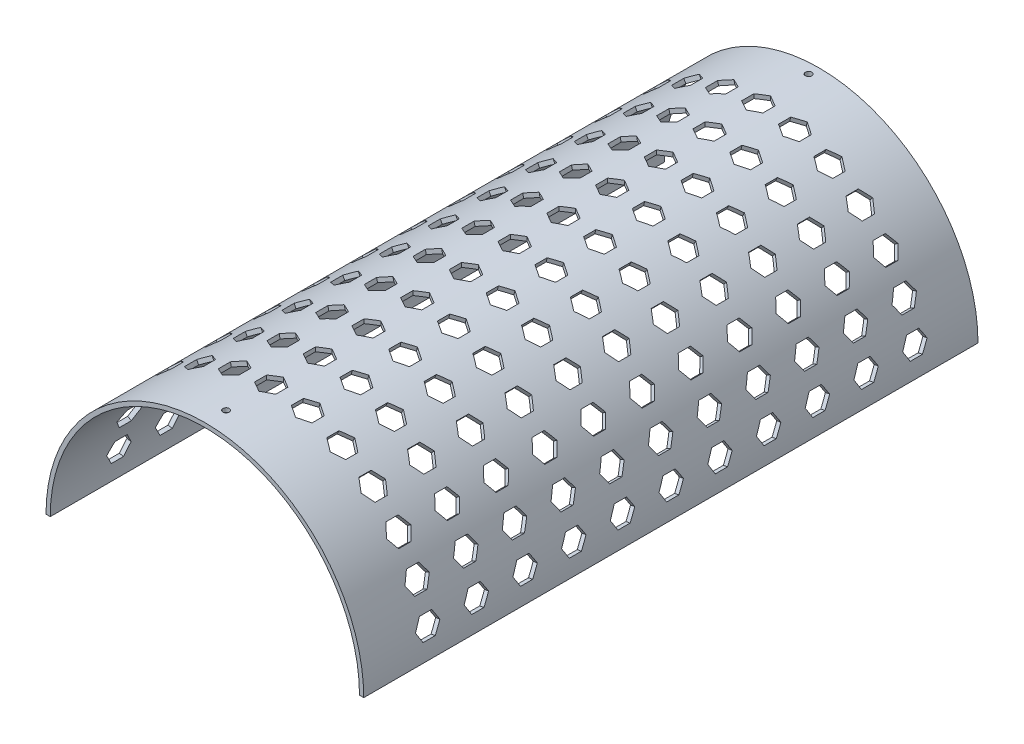
from build123d import *

# Parameters (mm, degrees)
BOSS_EXTRUDE1_DEPTH             = 290
CUT_EXTRUDE2_REACH              = 310.788
CUT_EXTRUDE2_END_RADIUS         = 75
SKETCH4_R                       = 1.5
CUT_EXTRUDE3_REACH              = 310.788
CUT_EXTRUDE3_END_RADIUS         = 75
CIRPATTERN1_COUNT               = 7
CIRPATTERN1_ANGLE               = 80
CIRPATTERN1_THE_OTHER_WAY_COUNT = 7
CIRPATTERN1_THE_OTHER_WAY_ANGLE = 80
LPATTERN1_COUNT                 = 11
LPATTERN1_PITCH                 = 23
LPATTERN1_COPY_1_REACH          = 310.788
LPATTERN1_COPY_1_END_RADIUS     = 75
LPATTERN1_COPY_2_REACH          = 310.788
LPATTERN1_COPY_2_END_RADIUS     = 75
LPATTERN1_COPY_3_REACH          = 310.788
LPATTERN1_COPY_3_END_RADIUS     = 75
LPATTERN1_COPY_4_REACH          = 310.788
LPATTERN1_COPY_4_END_RADIUS     = 75
LPATTERN1_COPY_5_REACH          = 310.788
LPATTERN1_COPY_5_END_RADIUS     = 75
LPATTERN1_COPY_6_REACH          = 310.788
LPATTERN1_COPY_6_END_RADIUS     = 75
LPATTERN1_COPY_7_REACH          = 310.788
LPATTERN1_COPY_7_END_RADIUS     = 75
LPATTERN1_COPY_8_REACH          = 310.788
LPATTERN1_COPY_8_END_RADIUS     = 75
LPATTERN1_COPY_9_REACH          = 310.788
LPATTERN1_COPY_9_END_RADIUS     = 75
LPATTERN1_COPY_10_REACH         = 310.788
LPATTERN1_COPY_10_END_RADIUS    = 75
LPATTERN1_COPY_11_REACH         = 310.788
LPATTERN1_COPY_11_END_RADIUS    = 75
LPATTERN1_COPY_12_REACH         = 310.788
LPATTERN1_COPY_12_END_RADIUS    = 75
LPATTERN1_COPY_13_REACH         = 310.788
LPATTERN1_COPY_13_END_RADIUS    = 75
LPATTERN1_COPY_14_REACH         = 310.788
LPATTERN1_COPY_14_END_RADIUS    = 75
LPATTERN1_COPY_15_REACH         = 310.788
LPATTERN1_COPY_15_END_RADIUS    = 75
LPATTERN1_COPY_16_REACH         = 310.788
LPATTERN1_COPY_16_END_RADIUS    = 75
LPATTERN1_COPY_17_REACH         = 310.788
LPATTERN1_COPY_17_END_RADIUS    = 75
LPATTERN1_COPY_18_REACH         = 310.788
LPATTERN1_COPY_18_END_RADIUS    = 75
LPATTERN1_COPY_19_REACH         = 310.788
LPATTERN1_COPY_19_END_RADIUS    = 75
LPATTERN1_COPY_20_REACH         = 310.788
LPATTERN1_COPY_20_END_RADIUS    = 75
LPATTERN1_COPY_21_REACH         = 310.788
LPATTERN1_COPY_21_END_RADIUS    = 75
LPATTERN1_COPY_22_REACH         = 310.788
LPATTERN1_COPY_22_END_RADIUS    = 75
LPATTERN1_COPY_23_REACH         = 310.788
LPATTERN1_COPY_23_END_RADIUS    = 75
LPATTERN1_COPY_24_REACH         = 310.788
LPATTERN1_COPY_24_END_RADIUS    = 75
LPATTERN1_COPY_25_REACH         = 310.788
LPATTERN1_COPY_25_END_RADIUS    = 75
LPATTERN1_COPY_26_REACH         = 310.788
LPATTERN1_COPY_26_END_RADIUS    = 75
LPATTERN1_COPY_27_REACH         = 310.788
LPATTERN1_COPY_27_END_RADIUS    = 75
LPATTERN1_COPY_28_REACH         = 310.788
LPATTERN1_COPY_28_END_RADIUS    = 75
LPATTERN1_COPY_29_REACH         = 310.788
LPATTERN1_COPY_29_END_RADIUS    = 75
LPATTERN1_COPY_30_REACH         = 310.788
LPATTERN1_COPY_30_END_RADIUS    = 75
LPATTERN1_COPY_31_REACH         = 310.788
LPATTERN1_COPY_31_END_RADIUS    = 75
LPATTERN1_COPY_32_REACH         = 310.788
LPATTERN1_COPY_32_END_RADIUS    = 75
LPATTERN1_COPY_33_REACH         = 310.788
LPATTERN1_COPY_33_END_RADIUS    = 75
LPATTERN1_COPY_34_REACH         = 310.788
LPATTERN1_COPY_34_END_RADIUS    = 75
LPATTERN1_COPY_35_REACH         = 310.788
LPATTERN1_COPY_35_END_RADIUS    = 75
LPATTERN1_COPY_36_REACH         = 310.788
LPATTERN1_COPY_36_END_RADIUS    = 75
LPATTERN1_COPY_37_REACH         = 310.788
LPATTERN1_COPY_37_END_RADIUS    = 75
LPATTERN1_COPY_38_REACH         = 310.788
LPATTERN1_COPY_38_END_RADIUS    = 75
LPATTERN1_COPY_39_REACH         = 310.788
LPATTERN1_COPY_39_END_RADIUS    = 75
LPATTERN1_COPY_40_REACH         = 310.788
LPATTERN1_COPY_40_END_RADIUS    = 75
LPATTERN1_COPY_41_REACH         = 310.788
LPATTERN1_COPY_41_END_RADIUS    = 75
LPATTERN1_COPY_42_REACH         = 310.788
LPATTERN1_COPY_42_END_RADIUS    = 75
LPATTERN1_COPY_43_REACH         = 310.788
LPATTERN1_COPY_43_END_RADIUS    = 75
LPATTERN1_COPY_44_REACH         = 310.788
LPATTERN1_COPY_44_END_RADIUS    = 75
LPATTERN1_COPY_45_REACH         = 310.788
LPATTERN1_COPY_45_END_RADIUS    = 75
LPATTERN1_COPY_46_REACH         = 310.788
LPATTERN1_COPY_46_END_RADIUS    = 75
LPATTERN1_COPY_47_REACH         = 310.788
LPATTERN1_COPY_47_END_RADIUS    = 75
LPATTERN1_COPY_48_REACH         = 310.788
LPATTERN1_COPY_48_END_RADIUS    = 75
LPATTERN1_COPY_49_REACH         = 310.788
LPATTERN1_COPY_49_END_RADIUS    = 75
LPATTERN1_COPY_50_REACH         = 310.788
LPATTERN1_COPY_50_END_RADIUS    = 75
LPATTERN1_COPY_51_REACH         = 310.788
LPATTERN1_COPY_51_END_RADIUS    = 75
LPATTERN1_COPY_52_REACH         = 310.788
LPATTERN1_COPY_52_END_RADIUS    = 75
LPATTERN1_COPY_53_REACH         = 310.788
LPATTERN1_COPY_53_END_RADIUS    = 75
LPATTERN1_COPY_54_REACH         = 310.788
LPATTERN1_COPY_54_END_RADIUS    = 75
LPATTERN1_COPY_55_REACH         = 310.788
LPATTERN1_COPY_55_END_RADIUS    = 75
LPATTERN1_COPY_56_REACH         = 310.788
LPATTERN1_COPY_56_END_RADIUS    = 75
LPATTERN1_COPY_57_REACH         = 310.788
LPATTERN1_COPY_57_END_RADIUS    = 75
LPATTERN1_COPY_58_REACH         = 310.788
LPATTERN1_COPY_58_END_RADIUS    = 75
LPATTERN1_COPY_59_REACH         = 310.788
LPATTERN1_COPY_59_END_RADIUS    = 75
LPATTERN1_COPY_60_REACH         = 310.788
LPATTERN1_COPY_60_END_RADIUS    = 75
LPATTERN1_COPY_61_REACH         = 310.788
LPATTERN1_COPY_61_END_RADIUS    = 75
LPATTERN1_COPY_62_REACH         = 310.788
LPATTERN1_COPY_62_END_RADIUS    = 75
LPATTERN1_COPY_63_REACH         = 310.788
LPATTERN1_COPY_63_END_RADIUS    = 75
LPATTERN1_COPY_64_REACH         = 310.788
LPATTERN1_COPY_64_END_RADIUS    = 75
LPATTERN1_COPY_65_REACH         = 310.788
LPATTERN1_COPY_65_END_RADIUS    = 75
LPATTERN1_COPY_66_REACH         = 310.788
LPATTERN1_COPY_66_END_RADIUS    = 75
LPATTERN1_COPY_67_REACH         = 310.788
LPATTERN1_COPY_67_END_RADIUS    = 75
LPATTERN1_COPY_68_REACH         = 310.788
LPATTERN1_COPY_68_END_RADIUS    = 75
LPATTERN1_COPY_69_REACH         = 310.788
LPATTERN1_COPY_69_END_RADIUS    = 75
LPATTERN1_COPY_70_REACH         = 310.788
LPATTERN1_COPY_70_END_RADIUS    = 75
LPATTERN1_COPY_71_REACH         = 310.788
LPATTERN1_COPY_71_END_RADIUS    = 75
LPATTERN1_COPY_72_REACH         = 310.788
LPATTERN1_COPY_72_END_RADIUS    = 75
LPATTERN1_COPY_73_REACH         = 310.788
LPATTERN1_COPY_73_END_RADIUS    = 75
LPATTERN1_COPY_74_REACH         = 310.788
LPATTERN1_COPY_74_END_RADIUS    = 75
LPATTERN1_COPY_75_REACH         = 310.788
LPATTERN1_COPY_75_END_RADIUS    = 75
LPATTERN1_COPY_76_REACH         = 310.788
LPATTERN1_COPY_76_END_RADIUS    = 75
LPATTERN1_COPY_77_REACH         = 310.788
LPATTERN1_COPY_77_END_RADIUS    = 75
LPATTERN1_COPY_78_REACH         = 310.788
LPATTERN1_COPY_78_END_RADIUS    = 75
LPATTERN1_COPY_79_REACH         = 310.788
LPATTERN1_COPY_79_END_RADIUS    = 75
LPATTERN1_COPY_80_REACH         = 310.788
LPATTERN1_COPY_80_END_RADIUS    = 75
LPATTERN1_COPY_81_REACH         = 310.788
LPATTERN1_COPY_81_END_RADIUS    = 75
LPATTERN1_COPY_82_REACH         = 310.788
LPATTERN1_COPY_82_END_RADIUS    = 75
LPATTERN1_COPY_83_REACH         = 310.788
LPATTERN1_COPY_83_END_RADIUS    = 75
LPATTERN1_COPY_84_REACH         = 310.788
LPATTERN1_COPY_84_END_RADIUS    = 75
LPATTERN1_COPY_85_REACH         = 310.788
LPATTERN1_COPY_85_END_RADIUS    = 75
LPATTERN1_COPY_86_REACH         = 310.788
LPATTERN1_COPY_86_END_RADIUS    = 75
LPATTERN1_COPY_87_REACH         = 310.788
LPATTERN1_COPY_87_END_RADIUS    = 75
LPATTERN1_COPY_88_REACH         = 310.788
LPATTERN1_COPY_88_END_RADIUS    = 75
LPATTERN1_COPY_89_REACH         = 310.788
LPATTERN1_COPY_89_END_RADIUS    = 75
LPATTERN1_COPY_90_REACH         = 310.788
LPATTERN1_COPY_90_END_RADIUS    = 75
LPATTERN1_COPY_91_REACH         = 310.788
LPATTERN1_COPY_91_END_RADIUS    = 75
LPATTERN1_COPY_92_REACH         = 310.788
LPATTERN1_COPY_92_END_RADIUS    = 75
LPATTERN1_COPY_93_REACH         = 310.788
LPATTERN1_COPY_93_END_RADIUS    = 75
LPATTERN1_COPY_94_REACH         = 310.788
LPATTERN1_COPY_94_END_RADIUS    = 75
LPATTERN1_COPY_95_REACH         = 310.788
LPATTERN1_COPY_95_END_RADIUS    = 75
LPATTERN1_COPY_96_REACH         = 310.788
LPATTERN1_COPY_96_END_RADIUS    = 75
LPATTERN1_COPY_97_REACH         = 310.788
LPATTERN1_COPY_97_END_RADIUS    = 75
LPATTERN1_COPY_98_REACH         = 310.788
LPATTERN1_COPY_98_END_RADIUS    = 75
LPATTERN1_COPY_99_REACH         = 310.788
LPATTERN1_COPY_99_END_RADIUS    = 75
LPATTERN1_COPY_100_REACH        = 310.788
LPATTERN1_COPY_100_END_RADIUS   = 75
LPATTERN1_COPY_101_REACH        = 310.788
LPATTERN1_COPY_101_END_RADIUS   = 75
LPATTERN1_COPY_102_REACH        = 310.788
LPATTERN1_COPY_102_END_RADIUS   = 75
LPATTERN1_COPY_103_REACH        = 310.788
LPATTERN1_COPY_103_END_RADIUS   = 75
LPATTERN1_COPY_104_REACH        = 310.788
LPATTERN1_COPY_104_END_RADIUS   = 75
LPATTERN1_COPY_105_REACH        = 310.788
LPATTERN1_COPY_105_END_RADIUS   = 75
LPATTERN1_COPY_106_REACH        = 310.788
LPATTERN1_COPY_106_END_RADIUS   = 75
LPATTERN1_COPY_107_REACH        = 310.788
LPATTERN1_COPY_107_END_RADIUS   = 75
LPATTERN1_COPY_108_REACH        = 310.788
LPATTERN1_COPY_108_END_RADIUS   = 75
LPATTERN1_COPY_109_REACH        = 310.788
LPATTERN1_COPY_109_END_RADIUS   = 75
LPATTERN1_COPY_110_REACH        = 310.788
LPATTERN1_COPY_110_END_RADIUS   = 75
LPATTERN1_COPY_111_REACH        = 310.788
LPATTERN1_COPY_111_END_RADIUS   = 75
LPATTERN1_COPY_112_REACH        = 310.788
LPATTERN1_COPY_112_END_RADIUS   = 75
LPATTERN1_COPY_113_REACH        = 310.788
LPATTERN1_COPY_113_END_RADIUS   = 75
LPATTERN1_COPY_114_REACH        = 310.788
LPATTERN1_COPY_114_END_RADIUS   = 75
LPATTERN1_COPY_115_REACH        = 310.788
LPATTERN1_COPY_115_END_RADIUS   = 75
LPATTERN1_COPY_116_REACH        = 310.788
LPATTERN1_COPY_116_END_RADIUS   = 75
LPATTERN1_COPY_117_REACH        = 310.788
LPATTERN1_COPY_117_END_RADIUS   = 75
LPATTERN1_COPY_118_REACH        = 310.788
LPATTERN1_COPY_118_END_RADIUS   = 75
LPATTERN1_COPY_119_REACH        = 310.788
LPATTERN1_COPY_119_END_RADIUS   = 75
LPATTERN1_COPY_120_REACH        = 310.788
LPATTERN1_COPY_120_END_RADIUS   = 75


with BuildPart() as part:
    # Sketch1 → Boss-Extrude1 (new body)
    with BuildSketch(Plane.XY):
        with BuildLine():
            Line((-75, 0), (-73, 0))
            ThreePointArc((-73, 0), (0, 73), (73, 0))
            Line((73, 0), (75, 0))
            ThreePointArc((75, 0), (0, 75), (-75, 0))
        make_face()
    extrude(amount=BOSS_EXTRUDE1_DEPTH)

    # Cut-Extrude2: up to this cylinder (the profile starts inside it)
    cut_extrude2_end = Plane(origin=(0, 0, 142.5), z_dir=(0, 0, -1)) * Cylinder(CUT_EXTRUDE2_END_RADIUS, 1047.576, mode=Mode.PRIVATE)
    # Sketch4 → Cut-Extrude2 (cut, up to the surface)
    with BuildSketch(Plane(origin=(0, 0, 0), x_dir=(1, 0, 0), z_dir=(0, 1, 0)), mode=Mode.PRIVATE) as cut_extrude2_sk1:
        with Locations((0, -5)):
            Circle(SKETCH4_R)
    cut_extrude2_tool1 = extrude(cut_extrude2_sk1.sketch, amount=CUT_EXTRUDE2_REACH, mode=Mode.PRIVATE) & cut_extrude2_end
    add(cut_extrude2_tool1.solids().sort_by_distance((0, 0, 5))[0], mode=Mode.SUBTRACT)
    # Sketch4 → Cut-Extrude2 (cut, up to the surface)
    with BuildSketch(Plane(origin=(0, 0, 0), x_dir=(1, 0, 0), z_dir=(0, 1, 0)), mode=Mode.PRIVATE) as cut_extrude2_sk2:
        with Locations((0, -280)):
            Circle(SKETCH4_R)
    cut_extrude2_tool2 = extrude(cut_extrude2_sk2.sketch, amount=CUT_EXTRUDE2_REACH, mode=Mode.PRIVATE) & cut_extrude2_end
    add(cut_extrude2_tool2.solids().sort_by_distance((0, 0, 280))[0], mode=Mode.SUBTRACT)

    # Cut-Extrude3: up to this cylinder (the profile starts inside it)
    cut_extrude3_end = Plane(origin=(0, 0, 28.692656), z_dir=(0, 0, -1)) * Cylinder(CUT_EXTRUDE3_END_RADIUS, 772.576, mode=Mode.PRIVATE)
    # Sketch2 → Cut-Extrude3 (cut, up to the surface)
    with BuildSketch(Plane(origin=(0, 0, 0), x_dir=(1, 0, 0), z_dir=(0, 1, 0)), mode=Mode.PRIVATE) as cut_extrude3_sk1:
        Polygon((5, -31.579407127), (5, -25.805904435), (0, -22.919153089), (-5, -25.805904435), (-5, -31.579407127), (0, -34.466158473), align=None)
    cut_extrude3_tool1 = extrude(cut_extrude3_sk1.sketch, amount=CUT_EXTRUDE3_REACH, mode=Mode.PRIVATE) & cut_extrude3_end
    cut_extrude3 = cut_extrude3_tool1.solids().sort_by_distance((0, 0, 28.692656))[0]
    add(cut_extrude3, mode=Mode.SUBTRACT)

    # CirPattern1: Cut-Extrude3 ×7 about axis
    cirpattern1_axis = Axis((0, 0, 290), (0, 0, 1))
    for i in range(1, CIRPATTERN1_COUNT):
        add(cut_extrude3.rotate(cirpattern1_axis, i * CIRPATTERN1_ANGLE / (CIRPATTERN1_COUNT - 1)), mode=Mode.SUBTRACT)

    # CirPattern1 the other way: Cut-Extrude3 ×7 about axis
    cirpattern1_the_other_way_axis = Axis((0, 0, 290), (0, 0, -1))
    for i in range(1, CIRPATTERN1_THE_OTHER_WAY_COUNT):
        add(cut_extrude3.rotate(cirpattern1_the_other_way_axis, i * CIRPATTERN1_THE_OTHER_WAY_ANGLE / (CIRPATTERN1_THE_OTHER_WAY_COUNT - 1)), mode=Mode.SUBTRACT)

    # LPattern1: Cut-Extrude3 ×11
    with Locations(*[(0, 0, i * LPATTERN1_PITCH) for i in range(1, LPATTERN1_COUNT)]):
        add(cut_extrude3, mode=Mode.SUBTRACT)

    # LPattern1 copy 1: up to this cylinder (the profile starts inside it)
    lpattern1_copy_1_end = Plane(origin=(0, 0, 28.692656), z_dir=(0, 0, -1)) * Cylinder(LPATTERN1_COPY_1_END_RADIUS, 772.576, mode=Mode.PRIVATE)
    # LPattern1 copy 1 sketch → LPattern1 copy 1 (cut, up to the surface)
    with BuildSketch(Plane(origin=(0, 0, 23), x_dir=(0.9730448705798237, 0.23061587074244067, 0), z_dir=(-0.23061587074244067, 0.9730448705798237, 0)), mode=Mode.PRIVATE) as lpattern1_copy_1_sk1:
        Polygon((5, -31.579407127), (5, -25.805904435), (0, -22.919153089), (-5, -25.805904435), (-5, -31.579407127), (0, -34.466158473), align=None)
    lpattern1_copy_1_tool1 = extrude(lpattern1_copy_1_sk1.sketch, amount=LPATTERN1_COPY_1_REACH, mode=Mode.PRIVATE) & lpattern1_copy_1_end
    add(lpattern1_copy_1_tool1.solids().sort_by_distance((0, 0, 28.692656))[0], mode=Mode.SUBTRACT)

    # LPattern1 copy 2: up to this cylinder (the profile starts inside it)
    lpattern1_copy_2_end = Plane(origin=(0, 0, 28.692656), z_dir=(0, 0, -1)) * Cylinder(LPATTERN1_COPY_2_END_RADIUS, 772.576, mode=Mode.PRIVATE)
    # LPattern1 copy 2 sketch → LPattern1 copy 2 (cut, up to the surface)
    with BuildSketch(Plane(origin=(0, 0, 46), x_dir=(0.9730448705798237, 0.23061587074244067, 0), z_dir=(-0.23061587074244067, 0.9730448705798237, 0)), mode=Mode.PRIVATE) as lpattern1_copy_2_sk1:
        Polygon((5, -31.579407127), (5, -25.805904435), (0, -22.919153089), (-5, -25.805904435), (-5, -31.579407127), (0, -34.466158473), align=None)
    lpattern1_copy_2_tool1 = extrude(lpattern1_copy_2_sk1.sketch, amount=LPATTERN1_COPY_2_REACH, mode=Mode.PRIVATE) & lpattern1_copy_2_end
    add(lpattern1_copy_2_tool1.solids().sort_by_distance((0, 0, 28.692656))[0], mode=Mode.SUBTRACT)

    # LPattern1 copy 3: up to this cylinder (the profile starts inside it)
    lpattern1_copy_3_end = Plane(origin=(0, 0, 28.692656), z_dir=(0, 0, -1)) * Cylinder(LPATTERN1_COPY_3_END_RADIUS, 772.576, mode=Mode.PRIVATE)
    # LPattern1 copy 3 sketch → LPattern1 copy 3 (cut, up to the surface)
    with BuildSketch(Plane(origin=(0, 0, 69), x_dir=(0.9730448705798237, 0.23061587074244067, 0), z_dir=(-0.23061587074244067, 0.9730448705798237, 0)), mode=Mode.PRIVATE) as lpattern1_copy_3_sk1:
        Polygon((5, -31.579407127), (5, -25.805904435), (0, -22.919153089), (-5, -25.805904435), (-5, -31.579407127), (0, -34.466158473), align=None)
    lpattern1_copy_3_tool1 = extrude(lpattern1_copy_3_sk1.sketch, amount=LPATTERN1_COPY_3_REACH, mode=Mode.PRIVATE) & lpattern1_copy_3_end
    add(lpattern1_copy_3_tool1.solids().sort_by_distance((0, 0, 28.692656))[0], mode=Mode.SUBTRACT)

    # LPattern1 copy 4: up to this cylinder (the profile starts inside it)
    lpattern1_copy_4_end = Plane(origin=(0, 0, 28.692656), z_dir=(0, 0, -1)) * Cylinder(LPATTERN1_COPY_4_END_RADIUS, 772.576, mode=Mode.PRIVATE)
    # LPattern1 copy 4 sketch → LPattern1 copy 4 (cut, up to the surface)
    with BuildSketch(Plane(origin=(0, 0, 92), x_dir=(0.9730448705798237, 0.23061587074244067, 0), z_dir=(-0.23061587074244067, 0.9730448705798237, 0)), mode=Mode.PRIVATE) as lpattern1_copy_4_sk1:
        Polygon((5, -31.579407127), (5, -25.805904435), (0, -22.919153089), (-5, -25.805904435), (-5, -31.579407127), (0, -34.466158473), align=None)
    lpattern1_copy_4_tool1 = extrude(lpattern1_copy_4_sk1.sketch, amount=LPATTERN1_COPY_4_REACH, mode=Mode.PRIVATE) & lpattern1_copy_4_end
    add(lpattern1_copy_4_tool1.solids().sort_by_distance((0, 0, 28.692656))[0], mode=Mode.SUBTRACT)

    # LPattern1 copy 5: up to this cylinder (the profile starts inside it)
    lpattern1_copy_5_end = Plane(origin=(0, 0, 28.692656), z_dir=(0, 0, -1)) * Cylinder(LPATTERN1_COPY_5_END_RADIUS, 772.576, mode=Mode.PRIVATE)
    # LPattern1 copy 5 sketch → LPattern1 copy 5 (cut, up to the surface)
    with BuildSketch(Plane(origin=(0, 0, 115), x_dir=(0.9730448705798237, 0.23061587074244067, 0), z_dir=(-0.23061587074244067, 0.9730448705798237, 0)), mode=Mode.PRIVATE) as lpattern1_copy_5_sk1:
        Polygon((5, -31.579407127), (5, -25.805904435), (0, -22.919153089), (-5, -25.805904435), (-5, -31.579407127), (0, -34.466158473), align=None)
    lpattern1_copy_5_tool1 = extrude(lpattern1_copy_5_sk1.sketch, amount=LPATTERN1_COPY_5_REACH, mode=Mode.PRIVATE) & lpattern1_copy_5_end
    add(lpattern1_copy_5_tool1.solids().sort_by_distance((0, 0, 28.692656))[0], mode=Mode.SUBTRACT)

    # LPattern1 copy 6: up to this cylinder (the profile starts inside it)
    lpattern1_copy_6_end = Plane(origin=(0, 0, 28.692656), z_dir=(0, 0, -1)) * Cylinder(LPATTERN1_COPY_6_END_RADIUS, 772.576, mode=Mode.PRIVATE)
    # LPattern1 copy 6 sketch → LPattern1 copy 6 (cut, up to the surface)
    with BuildSketch(Plane(origin=(0, 0, 138), x_dir=(0.9730448705798237, 0.23061587074244067, 0), z_dir=(-0.23061587074244067, 0.9730448705798237, 0)), mode=Mode.PRIVATE) as lpattern1_copy_6_sk1:
        Polygon((5, -31.579407127), (5, -25.805904435), (0, -22.919153089), (-5, -25.805904435), (-5, -31.579407127), (0, -34.466158473), align=None)
    lpattern1_copy_6_tool1 = extrude(lpattern1_copy_6_sk1.sketch, amount=LPATTERN1_COPY_6_REACH, mode=Mode.PRIVATE) & lpattern1_copy_6_end
    add(lpattern1_copy_6_tool1.solids().sort_by_distance((0, 0, 28.692656))[0], mode=Mode.SUBTRACT)

    # LPattern1 copy 7: up to this cylinder (the profile starts inside it)
    lpattern1_copy_7_end = Plane(origin=(0, 0, 28.692656), z_dir=(0, 0, -1)) * Cylinder(LPATTERN1_COPY_7_END_RADIUS, 772.576, mode=Mode.PRIVATE)
    # LPattern1 copy 7 sketch → LPattern1 copy 7 (cut, up to the surface)
    with BuildSketch(Plane(origin=(0, 0, 161), x_dir=(0.9730448705798237, 0.23061587074244067, 0), z_dir=(-0.23061587074244067, 0.9730448705798237, 0)), mode=Mode.PRIVATE) as lpattern1_copy_7_sk1:
        Polygon((5, -31.579407127), (5, -25.805904435), (0, -22.919153089), (-5, -25.805904435), (-5, -31.579407127), (0, -34.466158473), align=None)
    lpattern1_copy_7_tool1 = extrude(lpattern1_copy_7_sk1.sketch, amount=LPATTERN1_COPY_7_REACH, mode=Mode.PRIVATE) & lpattern1_copy_7_end
    add(lpattern1_copy_7_tool1.solids().sort_by_distance((0, 0, 28.692656))[0], mode=Mode.SUBTRACT)

    # LPattern1 copy 8: up to this cylinder (the profile starts inside it)
    lpattern1_copy_8_end = Plane(origin=(0, 0, 28.692656), z_dir=(0, 0, -1)) * Cylinder(LPATTERN1_COPY_8_END_RADIUS, 772.576, mode=Mode.PRIVATE)
    # LPattern1 copy 8 sketch → LPattern1 copy 8 (cut, up to the surface)
    with BuildSketch(Plane(origin=(0, 0, 184), x_dir=(0.9730448705798237, 0.23061587074244067, 0), z_dir=(-0.23061587074244067, 0.9730448705798237, 0)), mode=Mode.PRIVATE) as lpattern1_copy_8_sk1:
        Polygon((5, -31.579407127), (5, -25.805904435), (0, -22.919153089), (-5, -25.805904435), (-5, -31.579407127), (0, -34.466158473), align=None)
    lpattern1_copy_8_tool1 = extrude(lpattern1_copy_8_sk1.sketch, amount=LPATTERN1_COPY_8_REACH, mode=Mode.PRIVATE) & lpattern1_copy_8_end
    add(lpattern1_copy_8_tool1.solids().sort_by_distance((0, 0, 28.692656))[0], mode=Mode.SUBTRACT)

    # LPattern1 copy 9: up to this cylinder (the profile starts inside it)
    lpattern1_copy_9_end = Plane(origin=(0, 0, 28.692656), z_dir=(0, 0, -1)) * Cylinder(LPATTERN1_COPY_9_END_RADIUS, 772.576, mode=Mode.PRIVATE)
    # LPattern1 copy 9 sketch → LPattern1 copy 9 (cut, up to the surface)
    with BuildSketch(Plane(origin=(0, 0, 207), x_dir=(0.9730448705798237, 0.23061587074244067, 0), z_dir=(-0.23061587074244067, 0.9730448705798237, 0)), mode=Mode.PRIVATE) as lpattern1_copy_9_sk1:
        Polygon((5, -31.579407127), (5, -25.805904435), (0, -22.919153089), (-5, -25.805904435), (-5, -31.579407127), (0, -34.466158473), align=None)
    lpattern1_copy_9_tool1 = extrude(lpattern1_copy_9_sk1.sketch, amount=LPATTERN1_COPY_9_REACH, mode=Mode.PRIVATE) & lpattern1_copy_9_end
    add(lpattern1_copy_9_tool1.solids().sort_by_distance((0, 0, 28.692656))[0], mode=Mode.SUBTRACT)

    # LPattern1 copy 10: up to this cylinder (the profile starts inside it)
    lpattern1_copy_10_end = Plane(origin=(0, 0, 28.692656), z_dir=(0, 0, -1)) * Cylinder(LPATTERN1_COPY_10_END_RADIUS, 772.576, mode=Mode.PRIVATE)
    # LPattern1 copy 10 sketch → LPattern1 copy 10 (cut, up to the surface)
    with BuildSketch(Plane(origin=(0, 0, 230), x_dir=(0.9730448705798237, 0.23061587074244067, 0), z_dir=(-0.23061587074244067, 0.9730448705798237, 0)), mode=Mode.PRIVATE) as lpattern1_copy_10_sk1:
        Polygon((5, -31.579407127), (5, -25.805904435), (0, -22.919153089), (-5, -25.805904435), (-5, -31.579407127), (0, -34.466158473), align=None)
    lpattern1_copy_10_tool1 = extrude(lpattern1_copy_10_sk1.sketch, amount=LPATTERN1_COPY_10_REACH, mode=Mode.PRIVATE) & lpattern1_copy_10_end
    add(lpattern1_copy_10_tool1.solids().sort_by_distance((0, 0, 28.692656))[0], mode=Mode.SUBTRACT)

    # LPattern1 copy 11: up to this cylinder (the profile starts inside it)
    lpattern1_copy_11_end = Plane(origin=(0, 0, 28.692656), z_dir=(0, 0, -1)) * Cylinder(LPATTERN1_COPY_11_END_RADIUS, 772.576, mode=Mode.PRIVATE)
    # LPattern1 copy 11 sketch → LPattern1 copy 11 (cut, up to the surface)
    with BuildSketch(Plane(origin=(0, 0, 23), x_dir=(0.8936326403234118, 0.44879918020046305, 0), z_dir=(-0.44879918020046305, 0.8936326403234118, 0)), mode=Mode.PRIVATE) as lpattern1_copy_11_sk1:
        Polygon((5, -31.579407127), (5, -25.805904435), (0, -22.919153089), (-5, -25.805904435), (-5, -31.579407127), (0, -34.466158473), align=None)
    lpattern1_copy_11_tool1 = extrude(lpattern1_copy_11_sk1.sketch, amount=LPATTERN1_COPY_11_REACH, mode=Mode.PRIVATE) & lpattern1_copy_11_end
    add(lpattern1_copy_11_tool1.solids().sort_by_distance((0, 0, 28.692656))[0], mode=Mode.SUBTRACT)

    # LPattern1 copy 12: up to this cylinder (the profile starts inside it)
    lpattern1_copy_12_end = Plane(origin=(0, 0, 28.692656), z_dir=(0, 0, -1)) * Cylinder(LPATTERN1_COPY_12_END_RADIUS, 772.576, mode=Mode.PRIVATE)
    # LPattern1 copy 12 sketch → LPattern1 copy 12 (cut, up to the surface)
    with BuildSketch(Plane(origin=(0, 0, 46), x_dir=(0.8936326403234118, 0.44879918020046305, 0), z_dir=(-0.44879918020046305, 0.8936326403234118, 0)), mode=Mode.PRIVATE) as lpattern1_copy_12_sk1:
        Polygon((5, -31.579407127), (5, -25.805904435), (0, -22.919153089), (-5, -25.805904435), (-5, -31.579407127), (0, -34.466158473), align=None)
    lpattern1_copy_12_tool1 = extrude(lpattern1_copy_12_sk1.sketch, amount=LPATTERN1_COPY_12_REACH, mode=Mode.PRIVATE) & lpattern1_copy_12_end
    add(lpattern1_copy_12_tool1.solids().sort_by_distance((0, 0, 28.692656))[0], mode=Mode.SUBTRACT)

    # LPattern1 copy 13: up to this cylinder (the profile starts inside it)
    lpattern1_copy_13_end = Plane(origin=(0, 0, 28.692656), z_dir=(0, 0, -1)) * Cylinder(LPATTERN1_COPY_13_END_RADIUS, 772.576, mode=Mode.PRIVATE)
    # LPattern1 copy 13 sketch → LPattern1 copy 13 (cut, up to the surface)
    with BuildSketch(Plane(origin=(0, 0, 69), x_dir=(0.8936326403234118, 0.44879918020046305, 0), z_dir=(-0.44879918020046305, 0.8936326403234118, 0)), mode=Mode.PRIVATE) as lpattern1_copy_13_sk1:
        Polygon((5, -31.579407127), (5, -25.805904435), (0, -22.919153089), (-5, -25.805904435), (-5, -31.579407127), (0, -34.466158473), align=None)
    lpattern1_copy_13_tool1 = extrude(lpattern1_copy_13_sk1.sketch, amount=LPATTERN1_COPY_13_REACH, mode=Mode.PRIVATE) & lpattern1_copy_13_end
    add(lpattern1_copy_13_tool1.solids().sort_by_distance((0, 0, 28.692656))[0], mode=Mode.SUBTRACT)

    # LPattern1 copy 14: up to this cylinder (the profile starts inside it)
    lpattern1_copy_14_end = Plane(origin=(0, 0, 28.692656), z_dir=(0, 0, -1)) * Cylinder(LPATTERN1_COPY_14_END_RADIUS, 772.576, mode=Mode.PRIVATE)
    # LPattern1 copy 14 sketch → LPattern1 copy 14 (cut, up to the surface)
    with BuildSketch(Plane(origin=(0, 0, 92), x_dir=(0.8936326403234118, 0.44879918020046305, 0), z_dir=(-0.44879918020046305, 0.8936326403234118, 0)), mode=Mode.PRIVATE) as lpattern1_copy_14_sk1:
        Polygon((5, -31.579407127), (5, -25.805904435), (0, -22.919153089), (-5, -25.805904435), (-5, -31.579407127), (0, -34.466158473), align=None)
    lpattern1_copy_14_tool1 = extrude(lpattern1_copy_14_sk1.sketch, amount=LPATTERN1_COPY_14_REACH, mode=Mode.PRIVATE) & lpattern1_copy_14_end
    add(lpattern1_copy_14_tool1.solids().sort_by_distance((0, 0, 28.692656))[0], mode=Mode.SUBTRACT)

    # LPattern1 copy 15: up to this cylinder (the profile starts inside it)
    lpattern1_copy_15_end = Plane(origin=(0, 0, 28.692656), z_dir=(0, 0, -1)) * Cylinder(LPATTERN1_COPY_15_END_RADIUS, 772.576, mode=Mode.PRIVATE)
    # LPattern1 copy 15 sketch → LPattern1 copy 15 (cut, up to the surface)
    with BuildSketch(Plane(origin=(0, 0, 115), x_dir=(0.8936326403234118, 0.44879918020046305, 0), z_dir=(-0.44879918020046305, 0.8936326403234118, 0)), mode=Mode.PRIVATE) as lpattern1_copy_15_sk1:
        Polygon((5, -31.579407127), (5, -25.805904435), (0, -22.919153089), (-5, -25.805904435), (-5, -31.579407127), (0, -34.466158473), align=None)
    lpattern1_copy_15_tool1 = extrude(lpattern1_copy_15_sk1.sketch, amount=LPATTERN1_COPY_15_REACH, mode=Mode.PRIVATE) & lpattern1_copy_15_end
    add(lpattern1_copy_15_tool1.solids().sort_by_distance((0, 0, 28.692656))[0], mode=Mode.SUBTRACT)

    # LPattern1 copy 16: up to this cylinder (the profile starts inside it)
    lpattern1_copy_16_end = Plane(origin=(0, 0, 28.692656), z_dir=(0, 0, -1)) * Cylinder(LPATTERN1_COPY_16_END_RADIUS, 772.576, mode=Mode.PRIVATE)
    # LPattern1 copy 16 sketch → LPattern1 copy 16 (cut, up to the surface)
    with BuildSketch(Plane(origin=(0, 0, 138), x_dir=(0.8936326403234118, 0.44879918020046305, 0), z_dir=(-0.44879918020046305, 0.8936326403234118, 0)), mode=Mode.PRIVATE) as lpattern1_copy_16_sk1:
        Polygon((5, -31.579407127), (5, -25.805904435), (0, -22.919153089), (-5, -25.805904435), (-5, -31.579407127), (0, -34.466158473), align=None)
    lpattern1_copy_16_tool1 = extrude(lpattern1_copy_16_sk1.sketch, amount=LPATTERN1_COPY_16_REACH, mode=Mode.PRIVATE) & lpattern1_copy_16_end
    add(lpattern1_copy_16_tool1.solids().sort_by_distance((0, 0, 28.692656))[0], mode=Mode.SUBTRACT)

    # LPattern1 copy 17: up to this cylinder (the profile starts inside it)
    lpattern1_copy_17_end = Plane(origin=(0, 0, 28.692656), z_dir=(0, 0, -1)) * Cylinder(LPATTERN1_COPY_17_END_RADIUS, 772.576, mode=Mode.PRIVATE)
    # LPattern1 copy 17 sketch → LPattern1 copy 17 (cut, up to the surface)
    with BuildSketch(Plane(origin=(0, 0, 161), x_dir=(0.8936326403234118, 0.44879918020046305, 0), z_dir=(-0.44879918020046305, 0.8936326403234118, 0)), mode=Mode.PRIVATE) as lpattern1_copy_17_sk1:
        Polygon((5, -31.579407127), (5, -25.805904435), (0, -22.919153089), (-5, -25.805904435), (-5, -31.579407127), (0, -34.466158473), align=None)
    lpattern1_copy_17_tool1 = extrude(lpattern1_copy_17_sk1.sketch, amount=LPATTERN1_COPY_17_REACH, mode=Mode.PRIVATE) & lpattern1_copy_17_end
    add(lpattern1_copy_17_tool1.solids().sort_by_distance((0, 0, 28.692656))[0], mode=Mode.SUBTRACT)

    # LPattern1 copy 18: up to this cylinder (the profile starts inside it)
    lpattern1_copy_18_end = Plane(origin=(0, 0, 28.692656), z_dir=(0, 0, -1)) * Cylinder(LPATTERN1_COPY_18_END_RADIUS, 772.576, mode=Mode.PRIVATE)
    # LPattern1 copy 18 sketch → LPattern1 copy 18 (cut, up to the surface)
    with BuildSketch(Plane(origin=(0, 0, 184), x_dir=(0.8936326403234118, 0.44879918020046305, 0), z_dir=(-0.44879918020046305, 0.8936326403234118, 0)), mode=Mode.PRIVATE) as lpattern1_copy_18_sk1:
        Polygon((5, -31.579407127), (5, -25.805904435), (0, -22.919153089), (-5, -25.805904435), (-5, -31.579407127), (0, -34.466158473), align=None)
    lpattern1_copy_18_tool1 = extrude(lpattern1_copy_18_sk1.sketch, amount=LPATTERN1_COPY_18_REACH, mode=Mode.PRIVATE) & lpattern1_copy_18_end
    add(lpattern1_copy_18_tool1.solids().sort_by_distance((0, 0, 28.692656))[0], mode=Mode.SUBTRACT)

    # LPattern1 copy 19: up to this cylinder (the profile starts inside it)
    lpattern1_copy_19_end = Plane(origin=(0, 0, 28.692656), z_dir=(0, 0, -1)) * Cylinder(LPATTERN1_COPY_19_END_RADIUS, 772.576, mode=Mode.PRIVATE)
    # LPattern1 copy 19 sketch → LPattern1 copy 19 (cut, up to the surface)
    with BuildSketch(Plane(origin=(0, 0, 207), x_dir=(0.8936326403234118, 0.44879918020046305, 0), z_dir=(-0.44879918020046305, 0.8936326403234118, 0)), mode=Mode.PRIVATE) as lpattern1_copy_19_sk1:
        Polygon((5, -31.579407127), (5, -25.805904435), (0, -22.919153089), (-5, -25.805904435), (-5, -31.579407127), (0, -34.466158473), align=None)
    lpattern1_copy_19_tool1 = extrude(lpattern1_copy_19_sk1.sketch, amount=LPATTERN1_COPY_19_REACH, mode=Mode.PRIVATE) & lpattern1_copy_19_end
    add(lpattern1_copy_19_tool1.solids().sort_by_distance((0, 0, 28.692656))[0], mode=Mode.SUBTRACT)

    # LPattern1 copy 20: up to this cylinder (the profile starts inside it)
    lpattern1_copy_20_end = Plane(origin=(0, 0, 28.692656), z_dir=(0, 0, -1)) * Cylinder(LPATTERN1_COPY_20_END_RADIUS, 772.576, mode=Mode.PRIVATE)
    # LPattern1 copy 20 sketch → LPattern1 copy 20 (cut, up to the surface)
    with BuildSketch(Plane(origin=(0, 0, 230), x_dir=(0.8936326403234118, 0.44879918020046305, 0), z_dir=(-0.44879918020046305, 0.8936326403234118, 0)), mode=Mode.PRIVATE) as lpattern1_copy_20_sk1:
        Polygon((5, -31.579407127), (5, -25.805904435), (0, -22.919153089), (-5, -25.805904435), (-5, -31.579407127), (0, -34.466158473), align=None)
    lpattern1_copy_20_tool1 = extrude(lpattern1_copy_20_sk1.sketch, amount=LPATTERN1_COPY_20_REACH, mode=Mode.PRIVATE) & lpattern1_copy_20_end
    add(lpattern1_copy_20_tool1.solids().sort_by_distance((0, 0, 28.692656))[0], mode=Mode.SUBTRACT)

    # LPattern1 copy 21: up to this cylinder (the profile starts inside it)
    lpattern1_copy_21_end = Plane(origin=(0, 0, 28.692656), z_dir=(0, 0, -1)) * Cylinder(LPATTERN1_COPY_21_END_RADIUS, 772.576, mode=Mode.PRIVATE)
    # LPattern1 copy 21 sketch → LPattern1 copy 21 (cut, up to the surface)
    with BuildSketch(Plane(origin=(0, 0, 23), x_dir=(0.766044443118977, 0.6427876096865405, 0), z_dir=(-0.6427876096865405, 0.766044443118977, 0)), mode=Mode.PRIVATE) as lpattern1_copy_21_sk1:
        Polygon((5, -31.579407127), (5, -25.805904435), (0, -22.919153089), (-5, -25.805904435), (-5, -31.579407127), (0, -34.466158473), align=None)
    lpattern1_copy_21_tool1 = extrude(lpattern1_copy_21_sk1.sketch, amount=LPATTERN1_COPY_21_REACH, mode=Mode.PRIVATE) & lpattern1_copy_21_end
    add(lpattern1_copy_21_tool1.solids().sort_by_distance((0, 0, 28.692656))[0], mode=Mode.SUBTRACT)

    # LPattern1 copy 22: up to this cylinder (the profile starts inside it)
    lpattern1_copy_22_end = Plane(origin=(0, 0, 28.692656), z_dir=(0, 0, -1)) * Cylinder(LPATTERN1_COPY_22_END_RADIUS, 772.576, mode=Mode.PRIVATE)
    # LPattern1 copy 22 sketch → LPattern1 copy 22 (cut, up to the surface)
    with BuildSketch(Plane(origin=(0, 0, 46), x_dir=(0.766044443118977, 0.6427876096865405, 0), z_dir=(-0.6427876096865405, 0.766044443118977, 0)), mode=Mode.PRIVATE) as lpattern1_copy_22_sk1:
        Polygon((5, -31.579407127), (5, -25.805904435), (0, -22.919153089), (-5, -25.805904435), (-5, -31.579407127), (0, -34.466158473), align=None)
    lpattern1_copy_22_tool1 = extrude(lpattern1_copy_22_sk1.sketch, amount=LPATTERN1_COPY_22_REACH, mode=Mode.PRIVATE) & lpattern1_copy_22_end
    add(lpattern1_copy_22_tool1.solids().sort_by_distance((0, 0, 28.692656))[0], mode=Mode.SUBTRACT)

    # LPattern1 copy 23: up to this cylinder (the profile starts inside it)
    lpattern1_copy_23_end = Plane(origin=(0, 0, 28.692656), z_dir=(0, 0, -1)) * Cylinder(LPATTERN1_COPY_23_END_RADIUS, 772.576, mode=Mode.PRIVATE)
    # LPattern1 copy 23 sketch → LPattern1 copy 23 (cut, up to the surface)
    with BuildSketch(Plane(origin=(0, 0, 69), x_dir=(0.766044443118977, 0.6427876096865405, 0), z_dir=(-0.6427876096865405, 0.766044443118977, 0)), mode=Mode.PRIVATE) as lpattern1_copy_23_sk1:
        Polygon((5, -31.579407127), (5, -25.805904435), (0, -22.919153089), (-5, -25.805904435), (-5, -31.579407127), (0, -34.466158473), align=None)
    lpattern1_copy_23_tool1 = extrude(lpattern1_copy_23_sk1.sketch, amount=LPATTERN1_COPY_23_REACH, mode=Mode.PRIVATE) & lpattern1_copy_23_end
    add(lpattern1_copy_23_tool1.solids().sort_by_distance((0, 0, 28.692656))[0], mode=Mode.SUBTRACT)

    # LPattern1 copy 24: up to this cylinder (the profile starts inside it)
    lpattern1_copy_24_end = Plane(origin=(0, 0, 28.692656), z_dir=(0, 0, -1)) * Cylinder(LPATTERN1_COPY_24_END_RADIUS, 772.576, mode=Mode.PRIVATE)
    # LPattern1 copy 24 sketch → LPattern1 copy 24 (cut, up to the surface)
    with BuildSketch(Plane(origin=(0, 0, 92), x_dir=(0.766044443118977, 0.6427876096865405, 0), z_dir=(-0.6427876096865405, 0.766044443118977, 0)), mode=Mode.PRIVATE) as lpattern1_copy_24_sk1:
        Polygon((5, -31.579407127), (5, -25.805904435), (0, -22.919153089), (-5, -25.805904435), (-5, -31.579407127), (0, -34.466158473), align=None)
    lpattern1_copy_24_tool1 = extrude(lpattern1_copy_24_sk1.sketch, amount=LPATTERN1_COPY_24_REACH, mode=Mode.PRIVATE) & lpattern1_copy_24_end
    add(lpattern1_copy_24_tool1.solids().sort_by_distance((0, 0, 28.692656))[0], mode=Mode.SUBTRACT)

    # LPattern1 copy 25: up to this cylinder (the profile starts inside it)
    lpattern1_copy_25_end = Plane(origin=(0, 0, 28.692656), z_dir=(0, 0, -1)) * Cylinder(LPATTERN1_COPY_25_END_RADIUS, 772.576, mode=Mode.PRIVATE)
    # LPattern1 copy 25 sketch → LPattern1 copy 25 (cut, up to the surface)
    with BuildSketch(Plane(origin=(0, 0, 115), x_dir=(0.766044443118977, 0.6427876096865405, 0), z_dir=(-0.6427876096865405, 0.766044443118977, 0)), mode=Mode.PRIVATE) as lpattern1_copy_25_sk1:
        Polygon((5, -31.579407127), (5, -25.805904435), (0, -22.919153089), (-5, -25.805904435), (-5, -31.579407127), (0, -34.466158473), align=None)
    lpattern1_copy_25_tool1 = extrude(lpattern1_copy_25_sk1.sketch, amount=LPATTERN1_COPY_25_REACH, mode=Mode.PRIVATE) & lpattern1_copy_25_end
    add(lpattern1_copy_25_tool1.solids().sort_by_distance((0, 0, 28.692656))[0], mode=Mode.SUBTRACT)

    # LPattern1 copy 26: up to this cylinder (the profile starts inside it)
    lpattern1_copy_26_end = Plane(origin=(0, 0, 28.692656), z_dir=(0, 0, -1)) * Cylinder(LPATTERN1_COPY_26_END_RADIUS, 772.576, mode=Mode.PRIVATE)
    # LPattern1 copy 26 sketch → LPattern1 copy 26 (cut, up to the surface)
    with BuildSketch(Plane(origin=(0, 0, 138), x_dir=(0.766044443118977, 0.6427876096865405, 0), z_dir=(-0.6427876096865405, 0.766044443118977, 0)), mode=Mode.PRIVATE) as lpattern1_copy_26_sk1:
        Polygon((5, -31.579407127), (5, -25.805904435), (0, -22.919153089), (-5, -25.805904435), (-5, -31.579407127), (0, -34.466158473), align=None)
    lpattern1_copy_26_tool1 = extrude(lpattern1_copy_26_sk1.sketch, amount=LPATTERN1_COPY_26_REACH, mode=Mode.PRIVATE) & lpattern1_copy_26_end
    add(lpattern1_copy_26_tool1.solids().sort_by_distance((0, 0, 28.692656))[0], mode=Mode.SUBTRACT)

    # LPattern1 copy 27: up to this cylinder (the profile starts inside it)
    lpattern1_copy_27_end = Plane(origin=(0, 0, 28.692656), z_dir=(0, 0, -1)) * Cylinder(LPATTERN1_COPY_27_END_RADIUS, 772.576, mode=Mode.PRIVATE)
    # LPattern1 copy 27 sketch → LPattern1 copy 27 (cut, up to the surface)
    with BuildSketch(Plane(origin=(0, 0, 161), x_dir=(0.766044443118977, 0.6427876096865405, 0), z_dir=(-0.6427876096865405, 0.766044443118977, 0)), mode=Mode.PRIVATE) as lpattern1_copy_27_sk1:
        Polygon((5, -31.579407127), (5, -25.805904435), (0, -22.919153089), (-5, -25.805904435), (-5, -31.579407127), (0, -34.466158473), align=None)
    lpattern1_copy_27_tool1 = extrude(lpattern1_copy_27_sk1.sketch, amount=LPATTERN1_COPY_27_REACH, mode=Mode.PRIVATE) & lpattern1_copy_27_end
    add(lpattern1_copy_27_tool1.solids().sort_by_distance((0, 0, 28.692656))[0], mode=Mode.SUBTRACT)

    # LPattern1 copy 28: up to this cylinder (the profile starts inside it)
    lpattern1_copy_28_end = Plane(origin=(0, 0, 28.692656), z_dir=(0, 0, -1)) * Cylinder(LPATTERN1_COPY_28_END_RADIUS, 772.576, mode=Mode.PRIVATE)
    # LPattern1 copy 28 sketch → LPattern1 copy 28 (cut, up to the surface)
    with BuildSketch(Plane(origin=(0, 0, 184), x_dir=(0.766044443118977, 0.6427876096865405, 0), z_dir=(-0.6427876096865405, 0.766044443118977, 0)), mode=Mode.PRIVATE) as lpattern1_copy_28_sk1:
        Polygon((5, -31.579407127), (5, -25.805904435), (0, -22.919153089), (-5, -25.805904435), (-5, -31.579407127), (0, -34.466158473), align=None)
    lpattern1_copy_28_tool1 = extrude(lpattern1_copy_28_sk1.sketch, amount=LPATTERN1_COPY_28_REACH, mode=Mode.PRIVATE) & lpattern1_copy_28_end
    add(lpattern1_copy_28_tool1.solids().sort_by_distance((0, 0, 28.692656))[0], mode=Mode.SUBTRACT)

    # LPattern1 copy 29: up to this cylinder (the profile starts inside it)
    lpattern1_copy_29_end = Plane(origin=(0, 0, 28.692656), z_dir=(0, 0, -1)) * Cylinder(LPATTERN1_COPY_29_END_RADIUS, 772.576, mode=Mode.PRIVATE)
    # LPattern1 copy 29 sketch → LPattern1 copy 29 (cut, up to the surface)
    with BuildSketch(Plane(origin=(0, 0, 207), x_dir=(0.766044443118977, 0.6427876096865405, 0), z_dir=(-0.6427876096865405, 0.766044443118977, 0)), mode=Mode.PRIVATE) as lpattern1_copy_29_sk1:
        Polygon((5, -31.579407127), (5, -25.805904435), (0, -22.919153089), (-5, -25.805904435), (-5, -31.579407127), (0, -34.466158473), align=None)
    lpattern1_copy_29_tool1 = extrude(lpattern1_copy_29_sk1.sketch, amount=LPATTERN1_COPY_29_REACH, mode=Mode.PRIVATE) & lpattern1_copy_29_end
    add(lpattern1_copy_29_tool1.solids().sort_by_distance((0, 0, 28.692656))[0], mode=Mode.SUBTRACT)

    # LPattern1 copy 30: up to this cylinder (the profile starts inside it)
    lpattern1_copy_30_end = Plane(origin=(0, 0, 28.692656), z_dir=(0, 0, -1)) * Cylinder(LPATTERN1_COPY_30_END_RADIUS, 772.576, mode=Mode.PRIVATE)
    # LPattern1 copy 30 sketch → LPattern1 copy 30 (cut, up to the surface)
    with BuildSketch(Plane(origin=(0, 0, 230), x_dir=(0.766044443118977, 0.6427876096865405, 0), z_dir=(-0.6427876096865405, 0.766044443118977, 0)), mode=Mode.PRIVATE) as lpattern1_copy_30_sk1:
        Polygon((5, -31.579407127), (5, -25.805904435), (0, -22.919153089), (-5, -25.805904435), (-5, -31.579407127), (0, -34.466158473), align=None)
    lpattern1_copy_30_tool1 = extrude(lpattern1_copy_30_sk1.sketch, amount=LPATTERN1_COPY_30_REACH, mode=Mode.PRIVATE) & lpattern1_copy_30_end
    add(lpattern1_copy_30_tool1.solids().sort_by_distance((0, 0, 28.692656))[0], mode=Mode.SUBTRACT)

    # LPattern1 copy 31: up to this cylinder (the profile starts inside it)
    lpattern1_copy_31_end = Plane(origin=(0, 0, 28.692656), z_dir=(0, 0, -1)) * Cylinder(LPATTERN1_COPY_31_END_RADIUS, 772.576, mode=Mode.PRIVATE)
    # LPattern1 copy 31 sketch → LPattern1 copy 31 (cut, up to the surface)
    with BuildSketch(Plane(origin=(0, 0, 23), x_dir=(0.5971585917027846, 0.802123192755045, 0), z_dir=(-0.802123192755045, 0.5971585917027846, 0)), mode=Mode.PRIVATE) as lpattern1_copy_31_sk1:
        Polygon((5, -31.579407127), (5, -25.805904435), (0, -22.919153089), (-5, -25.805904435), (-5, -31.579407127), (0, -34.466158473), align=None)
    lpattern1_copy_31_tool1 = extrude(lpattern1_copy_31_sk1.sketch, amount=LPATTERN1_COPY_31_REACH, mode=Mode.PRIVATE) & lpattern1_copy_31_end
    add(lpattern1_copy_31_tool1.solids().sort_by_distance((0, 0, 28.692656))[0], mode=Mode.SUBTRACT)

    # LPattern1 copy 32: up to this cylinder (the profile starts inside it)
    lpattern1_copy_32_end = Plane(origin=(0, 0, 28.692656), z_dir=(0, 0, -1)) * Cylinder(LPATTERN1_COPY_32_END_RADIUS, 772.576, mode=Mode.PRIVATE)
    # LPattern1 copy 32 sketch → LPattern1 copy 32 (cut, up to the surface)
    with BuildSketch(Plane(origin=(0, 0, 46), x_dir=(0.5971585917027846, 0.802123192755045, 0), z_dir=(-0.802123192755045, 0.5971585917027846, 0)), mode=Mode.PRIVATE) as lpattern1_copy_32_sk1:
        Polygon((5, -31.579407127), (5, -25.805904435), (0, -22.919153089), (-5, -25.805904435), (-5, -31.579407127), (0, -34.466158473), align=None)
    lpattern1_copy_32_tool1 = extrude(lpattern1_copy_32_sk1.sketch, amount=LPATTERN1_COPY_32_REACH, mode=Mode.PRIVATE) & lpattern1_copy_32_end
    add(lpattern1_copy_32_tool1.solids().sort_by_distance((0, 0, 28.692656))[0], mode=Mode.SUBTRACT)

    # LPattern1 copy 33: up to this cylinder (the profile starts inside it)
    lpattern1_copy_33_end = Plane(origin=(0, 0, 28.692656), z_dir=(0, 0, -1)) * Cylinder(LPATTERN1_COPY_33_END_RADIUS, 772.576, mode=Mode.PRIVATE)
    # LPattern1 copy 33 sketch → LPattern1 copy 33 (cut, up to the surface)
    with BuildSketch(Plane(origin=(0, 0, 69), x_dir=(0.5971585917027846, 0.802123192755045, 0), z_dir=(-0.802123192755045, 0.5971585917027846, 0)), mode=Mode.PRIVATE) as lpattern1_copy_33_sk1:
        Polygon((5, -31.579407127), (5, -25.805904435), (0, -22.919153089), (-5, -25.805904435), (-5, -31.579407127), (0, -34.466158473), align=None)
    lpattern1_copy_33_tool1 = extrude(lpattern1_copy_33_sk1.sketch, amount=LPATTERN1_COPY_33_REACH, mode=Mode.PRIVATE) & lpattern1_copy_33_end
    add(lpattern1_copy_33_tool1.solids().sort_by_distance((0, 0, 28.692656))[0], mode=Mode.SUBTRACT)

    # LPattern1 copy 34: up to this cylinder (the profile starts inside it)
    lpattern1_copy_34_end = Plane(origin=(0, 0, 28.692656), z_dir=(0, 0, -1)) * Cylinder(LPATTERN1_COPY_34_END_RADIUS, 772.576, mode=Mode.PRIVATE)
    # LPattern1 copy 34 sketch → LPattern1 copy 34 (cut, up to the surface)
    with BuildSketch(Plane(origin=(0, 0, 92), x_dir=(0.5971585917027846, 0.802123192755045, 0), z_dir=(-0.802123192755045, 0.5971585917027846, 0)), mode=Mode.PRIVATE) as lpattern1_copy_34_sk1:
        Polygon((5, -31.579407127), (5, -25.805904435), (0, -22.919153089), (-5, -25.805904435), (-5, -31.579407127), (0, -34.466158473), align=None)
    lpattern1_copy_34_tool1 = extrude(lpattern1_copy_34_sk1.sketch, amount=LPATTERN1_COPY_34_REACH, mode=Mode.PRIVATE) & lpattern1_copy_34_end
    add(lpattern1_copy_34_tool1.solids().sort_by_distance((0, 0, 28.692656))[0], mode=Mode.SUBTRACT)

    # LPattern1 copy 35: up to this cylinder (the profile starts inside it)
    lpattern1_copy_35_end = Plane(origin=(0, 0, 28.692656), z_dir=(0, 0, -1)) * Cylinder(LPATTERN1_COPY_35_END_RADIUS, 772.576, mode=Mode.PRIVATE)
    # LPattern1 copy 35 sketch → LPattern1 copy 35 (cut, up to the surface)
    with BuildSketch(Plane(origin=(0, 0, 115), x_dir=(0.5971585917027846, 0.802123192755045, 0), z_dir=(-0.802123192755045, 0.5971585917027846, 0)), mode=Mode.PRIVATE) as lpattern1_copy_35_sk1:
        Polygon((5, -31.579407127), (5, -25.805904435), (0, -22.919153089), (-5, -25.805904435), (-5, -31.579407127), (0, -34.466158473), align=None)
    lpattern1_copy_35_tool1 = extrude(lpattern1_copy_35_sk1.sketch, amount=LPATTERN1_COPY_35_REACH, mode=Mode.PRIVATE) & lpattern1_copy_35_end
    add(lpattern1_copy_35_tool1.solids().sort_by_distance((0, 0, 28.692656))[0], mode=Mode.SUBTRACT)

    # LPattern1 copy 36: up to this cylinder (the profile starts inside it)
    lpattern1_copy_36_end = Plane(origin=(0, 0, 28.692656), z_dir=(0, 0, -1)) * Cylinder(LPATTERN1_COPY_36_END_RADIUS, 772.576, mode=Mode.PRIVATE)
    # LPattern1 copy 36 sketch → LPattern1 copy 36 (cut, up to the surface)
    with BuildSketch(Plane(origin=(0, 0, 138), x_dir=(0.5971585917027846, 0.802123192755045, 0), z_dir=(-0.802123192755045, 0.5971585917027846, 0)), mode=Mode.PRIVATE) as lpattern1_copy_36_sk1:
        Polygon((5, -31.579407127), (5, -25.805904435), (0, -22.919153089), (-5, -25.805904435), (-5, -31.579407127), (0, -34.466158473), align=None)
    lpattern1_copy_36_tool1 = extrude(lpattern1_copy_36_sk1.sketch, amount=LPATTERN1_COPY_36_REACH, mode=Mode.PRIVATE) & lpattern1_copy_36_end
    add(lpattern1_copy_36_tool1.solids().sort_by_distance((0, 0, 28.692656))[0], mode=Mode.SUBTRACT)

    # LPattern1 copy 37: up to this cylinder (the profile starts inside it)
    lpattern1_copy_37_end = Plane(origin=(0, 0, 28.692656), z_dir=(0, 0, -1)) * Cylinder(LPATTERN1_COPY_37_END_RADIUS, 772.576, mode=Mode.PRIVATE)
    # LPattern1 copy 37 sketch → LPattern1 copy 37 (cut, up to the surface)
    with BuildSketch(Plane(origin=(0, 0, 161), x_dir=(0.5971585917027846, 0.802123192755045, 0), z_dir=(-0.802123192755045, 0.5971585917027846, 0)), mode=Mode.PRIVATE) as lpattern1_copy_37_sk1:
        Polygon((5, -31.579407127), (5, -25.805904435), (0, -22.919153089), (-5, -25.805904435), (-5, -31.579407127), (0, -34.466158473), align=None)
    lpattern1_copy_37_tool1 = extrude(lpattern1_copy_37_sk1.sketch, amount=LPATTERN1_COPY_37_REACH, mode=Mode.PRIVATE) & lpattern1_copy_37_end
    add(lpattern1_copy_37_tool1.solids().sort_by_distance((0, 0, 28.692656))[0], mode=Mode.SUBTRACT)

    # LPattern1 copy 38: up to this cylinder (the profile starts inside it)
    lpattern1_copy_38_end = Plane(origin=(0, 0, 28.692656), z_dir=(0, 0, -1)) * Cylinder(LPATTERN1_COPY_38_END_RADIUS, 772.576, mode=Mode.PRIVATE)
    # LPattern1 copy 38 sketch → LPattern1 copy 38 (cut, up to the surface)
    with BuildSketch(Plane(origin=(0, 0, 184), x_dir=(0.5971585917027846, 0.802123192755045, 0), z_dir=(-0.802123192755045, 0.5971585917027846, 0)), mode=Mode.PRIVATE) as lpattern1_copy_38_sk1:
        Polygon((5, -31.579407127), (5, -25.805904435), (0, -22.919153089), (-5, -25.805904435), (-5, -31.579407127), (0, -34.466158473), align=None)
    lpattern1_copy_38_tool1 = extrude(lpattern1_copy_38_sk1.sketch, amount=LPATTERN1_COPY_38_REACH, mode=Mode.PRIVATE) & lpattern1_copy_38_end
    add(lpattern1_copy_38_tool1.solids().sort_by_distance((0, 0, 28.692656))[0], mode=Mode.SUBTRACT)

    # LPattern1 copy 39: up to this cylinder (the profile starts inside it)
    lpattern1_copy_39_end = Plane(origin=(0, 0, 28.692656), z_dir=(0, 0, -1)) * Cylinder(LPATTERN1_COPY_39_END_RADIUS, 772.576, mode=Mode.PRIVATE)
    # LPattern1 copy 39 sketch → LPattern1 copy 39 (cut, up to the surface)
    with BuildSketch(Plane(origin=(0, 0, 207), x_dir=(0.5971585917027846, 0.802123192755045, 0), z_dir=(-0.802123192755045, 0.5971585917027846, 0)), mode=Mode.PRIVATE) as lpattern1_copy_39_sk1:
        Polygon((5, -31.579407127), (5, -25.805904435), (0, -22.919153089), (-5, -25.805904435), (-5, -31.579407127), (0, -34.466158473), align=None)
    lpattern1_copy_39_tool1 = extrude(lpattern1_copy_39_sk1.sketch, amount=LPATTERN1_COPY_39_REACH, mode=Mode.PRIVATE) & lpattern1_copy_39_end
    add(lpattern1_copy_39_tool1.solids().sort_by_distance((0, 0, 28.692656))[0], mode=Mode.SUBTRACT)

    # LPattern1 copy 40: up to this cylinder (the profile starts inside it)
    lpattern1_copy_40_end = Plane(origin=(0, 0, 28.692656), z_dir=(0, 0, -1)) * Cylinder(LPATTERN1_COPY_40_END_RADIUS, 772.576, mode=Mode.PRIVATE)
    # LPattern1 copy 40 sketch → LPattern1 copy 40 (cut, up to the surface)
    with BuildSketch(Plane(origin=(0, 0, 230), x_dir=(0.5971585917027846, 0.802123192755045, 0), z_dir=(-0.802123192755045, 0.5971585917027846, 0)), mode=Mode.PRIVATE) as lpattern1_copy_40_sk1:
        Polygon((5, -31.579407127), (5, -25.805904435), (0, -22.919153089), (-5, -25.805904435), (-5, -31.579407127), (0, -34.466158473), align=None)
    lpattern1_copy_40_tool1 = extrude(lpattern1_copy_40_sk1.sketch, amount=LPATTERN1_COPY_40_REACH, mode=Mode.PRIVATE) & lpattern1_copy_40_end
    add(lpattern1_copy_40_tool1.solids().sort_by_distance((0, 0, 28.692656))[0], mode=Mode.SUBTRACT)

    # LPattern1 copy 41: up to this cylinder (the profile starts inside it)
    lpattern1_copy_41_end = Plane(origin=(0, 0, 28.692656), z_dir=(0, 0, -1)) * Cylinder(LPATTERN1_COPY_41_END_RADIUS, 772.576, mode=Mode.PRIVATE)
    # LPattern1 copy 41 sketch → LPattern1 copy 41 (cut, up to the surface)
    with BuildSketch(Plane(origin=(0, 0, 23), x_dir=(0.39607976603915446, 0.918216106880275, 0), z_dir=(-0.918216106880275, 0.39607976603915446, 0)), mode=Mode.PRIVATE) as lpattern1_copy_41_sk1:
        Polygon((5, -31.579407127), (5, -25.805904435), (0, -22.919153089), (-5, -25.805904435), (-5, -31.579407127), (0, -34.466158473), align=None)
    lpattern1_copy_41_tool1 = extrude(lpattern1_copy_41_sk1.sketch, amount=LPATTERN1_COPY_41_REACH, mode=Mode.PRIVATE) & lpattern1_copy_41_end
    add(lpattern1_copy_41_tool1.solids().sort_by_distance((0, 0, 28.692656))[0], mode=Mode.SUBTRACT)

    # LPattern1 copy 42: up to this cylinder (the profile starts inside it)
    lpattern1_copy_42_end = Plane(origin=(0, 0, 28.692656), z_dir=(0, 0, -1)) * Cylinder(LPATTERN1_COPY_42_END_RADIUS, 772.576, mode=Mode.PRIVATE)
    # LPattern1 copy 42 sketch → LPattern1 copy 42 (cut, up to the surface)
    with BuildSketch(Plane(origin=(0, 0, 46), x_dir=(0.39607976603915446, 0.918216106880275, 0), z_dir=(-0.918216106880275, 0.39607976603915446, 0)), mode=Mode.PRIVATE) as lpattern1_copy_42_sk1:
        Polygon((5, -31.579407127), (5, -25.805904435), (0, -22.919153089), (-5, -25.805904435), (-5, -31.579407127), (0, -34.466158473), align=None)
    lpattern1_copy_42_tool1 = extrude(lpattern1_copy_42_sk1.sketch, amount=LPATTERN1_COPY_42_REACH, mode=Mode.PRIVATE) & lpattern1_copy_42_end
    add(lpattern1_copy_42_tool1.solids().sort_by_distance((0, 0, 28.692656))[0], mode=Mode.SUBTRACT)

    # LPattern1 copy 43: up to this cylinder (the profile starts inside it)
    lpattern1_copy_43_end = Plane(origin=(0, 0, 28.692656), z_dir=(0, 0, -1)) * Cylinder(LPATTERN1_COPY_43_END_RADIUS, 772.576, mode=Mode.PRIVATE)
    # LPattern1 copy 43 sketch → LPattern1 copy 43 (cut, up to the surface)
    with BuildSketch(Plane(origin=(0, 0, 69), x_dir=(0.39607976603915446, 0.918216106880275, 0), z_dir=(-0.918216106880275, 0.39607976603915446, 0)), mode=Mode.PRIVATE) as lpattern1_copy_43_sk1:
        Polygon((5, -31.579407127), (5, -25.805904435), (0, -22.919153089), (-5, -25.805904435), (-5, -31.579407127), (0, -34.466158473), align=None)
    lpattern1_copy_43_tool1 = extrude(lpattern1_copy_43_sk1.sketch, amount=LPATTERN1_COPY_43_REACH, mode=Mode.PRIVATE) & lpattern1_copy_43_end
    add(lpattern1_copy_43_tool1.solids().sort_by_distance((0, 0, 28.692656))[0], mode=Mode.SUBTRACT)

    # LPattern1 copy 44: up to this cylinder (the profile starts inside it)
    lpattern1_copy_44_end = Plane(origin=(0, 0, 28.692656), z_dir=(0, 0, -1)) * Cylinder(LPATTERN1_COPY_44_END_RADIUS, 772.576, mode=Mode.PRIVATE)
    # LPattern1 copy 44 sketch → LPattern1 copy 44 (cut, up to the surface)
    with BuildSketch(Plane(origin=(0, 0, 92), x_dir=(0.39607976603915446, 0.918216106880275, 0), z_dir=(-0.918216106880275, 0.39607976603915446, 0)), mode=Mode.PRIVATE) as lpattern1_copy_44_sk1:
        Polygon((5, -31.579407127), (5, -25.805904435), (0, -22.919153089), (-5, -25.805904435), (-5, -31.579407127), (0, -34.466158473), align=None)
    lpattern1_copy_44_tool1 = extrude(lpattern1_copy_44_sk1.sketch, amount=LPATTERN1_COPY_44_REACH, mode=Mode.PRIVATE) & lpattern1_copy_44_end
    add(lpattern1_copy_44_tool1.solids().sort_by_distance((0, 0, 28.692656))[0], mode=Mode.SUBTRACT)

    # LPattern1 copy 45: up to this cylinder (the profile starts inside it)
    lpattern1_copy_45_end = Plane(origin=(0, 0, 28.692656), z_dir=(0, 0, -1)) * Cylinder(LPATTERN1_COPY_45_END_RADIUS, 772.576, mode=Mode.PRIVATE)
    # LPattern1 copy 45 sketch → LPattern1 copy 45 (cut, up to the surface)
    with BuildSketch(Plane(origin=(0, 0, 115), x_dir=(0.39607976603915446, 0.918216106880275, 0), z_dir=(-0.918216106880275, 0.39607976603915446, 0)), mode=Mode.PRIVATE) as lpattern1_copy_45_sk1:
        Polygon((5, -31.579407127), (5, -25.805904435), (0, -22.919153089), (-5, -25.805904435), (-5, -31.579407127), (0, -34.466158473), align=None)
    lpattern1_copy_45_tool1 = extrude(lpattern1_copy_45_sk1.sketch, amount=LPATTERN1_COPY_45_REACH, mode=Mode.PRIVATE) & lpattern1_copy_45_end
    add(lpattern1_copy_45_tool1.solids().sort_by_distance((0, 0, 28.692656))[0], mode=Mode.SUBTRACT)

    # LPattern1 copy 46: up to this cylinder (the profile starts inside it)
    lpattern1_copy_46_end = Plane(origin=(0, 0, 28.692656), z_dir=(0, 0, -1)) * Cylinder(LPATTERN1_COPY_46_END_RADIUS, 772.576, mode=Mode.PRIVATE)
    # LPattern1 copy 46 sketch → LPattern1 copy 46 (cut, up to the surface)
    with BuildSketch(Plane(origin=(0, 0, 138), x_dir=(0.39607976603915446, 0.918216106880275, 0), z_dir=(-0.918216106880275, 0.39607976603915446, 0)), mode=Mode.PRIVATE) as lpattern1_copy_46_sk1:
        Polygon((5, -31.579407127), (5, -25.805904435), (0, -22.919153089), (-5, -25.805904435), (-5, -31.579407127), (0, -34.466158473), align=None)
    lpattern1_copy_46_tool1 = extrude(lpattern1_copy_46_sk1.sketch, amount=LPATTERN1_COPY_46_REACH, mode=Mode.PRIVATE) & lpattern1_copy_46_end
    add(lpattern1_copy_46_tool1.solids().sort_by_distance((0, 0, 28.692656))[0], mode=Mode.SUBTRACT)

    # LPattern1 copy 47: up to this cylinder (the profile starts inside it)
    lpattern1_copy_47_end = Plane(origin=(0, 0, 28.692656), z_dir=(0, 0, -1)) * Cylinder(LPATTERN1_COPY_47_END_RADIUS, 772.576, mode=Mode.PRIVATE)
    # LPattern1 copy 47 sketch → LPattern1 copy 47 (cut, up to the surface)
    with BuildSketch(Plane(origin=(0, 0, 161), x_dir=(0.39607976603915446, 0.918216106880275, 0), z_dir=(-0.918216106880275, 0.39607976603915446, 0)), mode=Mode.PRIVATE) as lpattern1_copy_47_sk1:
        Polygon((5, -31.579407127), (5, -25.805904435), (0, -22.919153089), (-5, -25.805904435), (-5, -31.579407127), (0, -34.466158473), align=None)
    lpattern1_copy_47_tool1 = extrude(lpattern1_copy_47_sk1.sketch, amount=LPATTERN1_COPY_47_REACH, mode=Mode.PRIVATE) & lpattern1_copy_47_end
    add(lpattern1_copy_47_tool1.solids().sort_by_distance((0, 0, 28.692656))[0], mode=Mode.SUBTRACT)

    # LPattern1 copy 48: up to this cylinder (the profile starts inside it)
    lpattern1_copy_48_end = Plane(origin=(0, 0, 28.692656), z_dir=(0, 0, -1)) * Cylinder(LPATTERN1_COPY_48_END_RADIUS, 772.576, mode=Mode.PRIVATE)
    # LPattern1 copy 48 sketch → LPattern1 copy 48 (cut, up to the surface)
    with BuildSketch(Plane(origin=(0, 0, 184), x_dir=(0.39607976603915446, 0.918216106880275, 0), z_dir=(-0.918216106880275, 0.39607976603915446, 0)), mode=Mode.PRIVATE) as lpattern1_copy_48_sk1:
        Polygon((5, -31.579407127), (5, -25.805904435), (0, -22.919153089), (-5, -25.805904435), (-5, -31.579407127), (0, -34.466158473), align=None)
    lpattern1_copy_48_tool1 = extrude(lpattern1_copy_48_sk1.sketch, amount=LPATTERN1_COPY_48_REACH, mode=Mode.PRIVATE) & lpattern1_copy_48_end
    add(lpattern1_copy_48_tool1.solids().sort_by_distance((0, 0, 28.692656))[0], mode=Mode.SUBTRACT)

    # LPattern1 copy 49: up to this cylinder (the profile starts inside it)
    lpattern1_copy_49_end = Plane(origin=(0, 0, 28.692656), z_dir=(0, 0, -1)) * Cylinder(LPATTERN1_COPY_49_END_RADIUS, 772.576, mode=Mode.PRIVATE)
    # LPattern1 copy 49 sketch → LPattern1 copy 49 (cut, up to the surface)
    with BuildSketch(Plane(origin=(0, 0, 207), x_dir=(0.39607976603915446, 0.918216106880275, 0), z_dir=(-0.918216106880275, 0.39607976603915446, 0)), mode=Mode.PRIVATE) as lpattern1_copy_49_sk1:
        Polygon((5, -31.579407127), (5, -25.805904435), (0, -22.919153089), (-5, -25.805904435), (-5, -31.579407127), (0, -34.466158473), align=None)
    lpattern1_copy_49_tool1 = extrude(lpattern1_copy_49_sk1.sketch, amount=LPATTERN1_COPY_49_REACH, mode=Mode.PRIVATE) & lpattern1_copy_49_end
    add(lpattern1_copy_49_tool1.solids().sort_by_distance((0, 0, 28.692656))[0], mode=Mode.SUBTRACT)

    # LPattern1 copy 50: up to this cylinder (the profile starts inside it)
    lpattern1_copy_50_end = Plane(origin=(0, 0, 28.692656), z_dir=(0, 0, -1)) * Cylinder(LPATTERN1_COPY_50_END_RADIUS, 772.576, mode=Mode.PRIVATE)
    # LPattern1 copy 50 sketch → LPattern1 copy 50 (cut, up to the surface)
    with BuildSketch(Plane(origin=(0, 0, 230), x_dir=(0.39607976603915446, 0.918216106880275, 0), z_dir=(-0.918216106880275, 0.39607976603915446, 0)), mode=Mode.PRIVATE) as lpattern1_copy_50_sk1:
        Polygon((5, -31.579407127), (5, -25.805904435), (0, -22.919153089), (-5, -25.805904435), (-5, -31.579407127), (0, -34.466158473), align=None)
    lpattern1_copy_50_tool1 = extrude(lpattern1_copy_50_sk1.sketch, amount=LPATTERN1_COPY_50_REACH, mode=Mode.PRIVATE) & lpattern1_copy_50_end
    add(lpattern1_copy_50_tool1.solids().sort_by_distance((0, 0, 28.692656))[0], mode=Mode.SUBTRACT)

    # LPattern1 copy 51: up to this cylinder (the profile starts inside it)
    lpattern1_copy_51_end = Plane(origin=(0, 0, 28.692656), z_dir=(0, 0, -1)) * Cylinder(LPATTERN1_COPY_51_END_RADIUS, 772.576, mode=Mode.PRIVATE)
    # LPattern1 copy 51 sketch → LPattern1 copy 51 (cut, up to the surface)
    with BuildSketch(Plane(origin=(0, 0, 23), x_dir=(0.17364817766692736, 0.9848077530122086, 0), z_dir=(-0.9848077530122086, 0.17364817766692736, 0)), mode=Mode.PRIVATE) as lpattern1_copy_51_sk1:
        Polygon((5, -31.579407127), (5, -25.805904435), (0, -22.919153089), (-5, -25.805904435), (-5, -31.579407127), (0, -34.466158473), align=None)
    lpattern1_copy_51_tool1 = extrude(lpattern1_copy_51_sk1.sketch, amount=LPATTERN1_COPY_51_REACH, mode=Mode.PRIVATE) & lpattern1_copy_51_end
    add(lpattern1_copy_51_tool1.solids().sort_by_distance((0, 0, 28.692656))[0], mode=Mode.SUBTRACT)

    # LPattern1 copy 52: up to this cylinder (the profile starts inside it)
    lpattern1_copy_52_end = Plane(origin=(0, 0, 28.692656), z_dir=(0, 0, -1)) * Cylinder(LPATTERN1_COPY_52_END_RADIUS, 772.576, mode=Mode.PRIVATE)
    # LPattern1 copy 52 sketch → LPattern1 copy 52 (cut, up to the surface)
    with BuildSketch(Plane(origin=(0, 0, 46), x_dir=(0.17364817766692736, 0.9848077530122086, 0), z_dir=(-0.9848077530122086, 0.17364817766692736, 0)), mode=Mode.PRIVATE) as lpattern1_copy_52_sk1:
        Polygon((5, -31.579407127), (5, -25.805904435), (0, -22.919153089), (-5, -25.805904435), (-5, -31.579407127), (0, -34.466158473), align=None)
    lpattern1_copy_52_tool1 = extrude(lpattern1_copy_52_sk1.sketch, amount=LPATTERN1_COPY_52_REACH, mode=Mode.PRIVATE) & lpattern1_copy_52_end
    add(lpattern1_copy_52_tool1.solids().sort_by_distance((0, 0, 28.692656))[0], mode=Mode.SUBTRACT)

    # LPattern1 copy 53: up to this cylinder (the profile starts inside it)
    lpattern1_copy_53_end = Plane(origin=(0, 0, 28.692656), z_dir=(0, 0, -1)) * Cylinder(LPATTERN1_COPY_53_END_RADIUS, 772.576, mode=Mode.PRIVATE)
    # LPattern1 copy 53 sketch → LPattern1 copy 53 (cut, up to the surface)
    with BuildSketch(Plane(origin=(0, 0, 69), x_dir=(0.17364817766692736, 0.9848077530122086, 0), z_dir=(-0.9848077530122086, 0.17364817766692736, 0)), mode=Mode.PRIVATE) as lpattern1_copy_53_sk1:
        Polygon((5, -31.579407127), (5, -25.805904435), (0, -22.919153089), (-5, -25.805904435), (-5, -31.579407127), (0, -34.466158473), align=None)
    lpattern1_copy_53_tool1 = extrude(lpattern1_copy_53_sk1.sketch, amount=LPATTERN1_COPY_53_REACH, mode=Mode.PRIVATE) & lpattern1_copy_53_end
    add(lpattern1_copy_53_tool1.solids().sort_by_distance((0, 0, 28.692656))[0], mode=Mode.SUBTRACT)

    # LPattern1 copy 54: up to this cylinder (the profile starts inside it)
    lpattern1_copy_54_end = Plane(origin=(0, 0, 28.692656), z_dir=(0, 0, -1)) * Cylinder(LPATTERN1_COPY_54_END_RADIUS, 772.576, mode=Mode.PRIVATE)
    # LPattern1 copy 54 sketch → LPattern1 copy 54 (cut, up to the surface)
    with BuildSketch(Plane(origin=(0, 0, 92), x_dir=(0.17364817766692736, 0.9848077530122086, 0), z_dir=(-0.9848077530122086, 0.17364817766692736, 0)), mode=Mode.PRIVATE) as lpattern1_copy_54_sk1:
        Polygon((5, -31.579407127), (5, -25.805904435), (0, -22.919153089), (-5, -25.805904435), (-5, -31.579407127), (0, -34.466158473), align=None)
    lpattern1_copy_54_tool1 = extrude(lpattern1_copy_54_sk1.sketch, amount=LPATTERN1_COPY_54_REACH, mode=Mode.PRIVATE) & lpattern1_copy_54_end
    add(lpattern1_copy_54_tool1.solids().sort_by_distance((0, 0, 28.692656))[0], mode=Mode.SUBTRACT)

    # LPattern1 copy 55: up to this cylinder (the profile starts inside it)
    lpattern1_copy_55_end = Plane(origin=(0, 0, 28.692656), z_dir=(0, 0, -1)) * Cylinder(LPATTERN1_COPY_55_END_RADIUS, 772.576, mode=Mode.PRIVATE)
    # LPattern1 copy 55 sketch → LPattern1 copy 55 (cut, up to the surface)
    with BuildSketch(Plane(origin=(0, 0, 115), x_dir=(0.17364817766692736, 0.9848077530122086, 0), z_dir=(-0.9848077530122086, 0.17364817766692736, 0)), mode=Mode.PRIVATE) as lpattern1_copy_55_sk1:
        Polygon((5, -31.579407127), (5, -25.805904435), (0, -22.919153089), (-5, -25.805904435), (-5, -31.579407127), (0, -34.466158473), align=None)
    lpattern1_copy_55_tool1 = extrude(lpattern1_copy_55_sk1.sketch, amount=LPATTERN1_COPY_55_REACH, mode=Mode.PRIVATE) & lpattern1_copy_55_end
    add(lpattern1_copy_55_tool1.solids().sort_by_distance((0, 0, 28.692656))[0], mode=Mode.SUBTRACT)

    # LPattern1 copy 56: up to this cylinder (the profile starts inside it)
    lpattern1_copy_56_end = Plane(origin=(0, 0, 28.692656), z_dir=(0, 0, -1)) * Cylinder(LPATTERN1_COPY_56_END_RADIUS, 772.576, mode=Mode.PRIVATE)
    # LPattern1 copy 56 sketch → LPattern1 copy 56 (cut, up to the surface)
    with BuildSketch(Plane(origin=(0, 0, 138), x_dir=(0.17364817766692736, 0.9848077530122086, 0), z_dir=(-0.9848077530122086, 0.17364817766692736, 0)), mode=Mode.PRIVATE) as lpattern1_copy_56_sk1:
        Polygon((5, -31.579407127), (5, -25.805904435), (0, -22.919153089), (-5, -25.805904435), (-5, -31.579407127), (0, -34.466158473), align=None)
    lpattern1_copy_56_tool1 = extrude(lpattern1_copy_56_sk1.sketch, amount=LPATTERN1_COPY_56_REACH, mode=Mode.PRIVATE) & lpattern1_copy_56_end
    add(lpattern1_copy_56_tool1.solids().sort_by_distance((0, 0, 28.692656))[0], mode=Mode.SUBTRACT)

    # LPattern1 copy 57: up to this cylinder (the profile starts inside it)
    lpattern1_copy_57_end = Plane(origin=(0, 0, 28.692656), z_dir=(0, 0, -1)) * Cylinder(LPATTERN1_COPY_57_END_RADIUS, 772.576, mode=Mode.PRIVATE)
    # LPattern1 copy 57 sketch → LPattern1 copy 57 (cut, up to the surface)
    with BuildSketch(Plane(origin=(0, 0, 161), x_dir=(0.17364817766692736, 0.9848077530122086, 0), z_dir=(-0.9848077530122086, 0.17364817766692736, 0)), mode=Mode.PRIVATE) as lpattern1_copy_57_sk1:
        Polygon((5, -31.579407127), (5, -25.805904435), (0, -22.919153089), (-5, -25.805904435), (-5, -31.579407127), (0, -34.466158473), align=None)
    lpattern1_copy_57_tool1 = extrude(lpattern1_copy_57_sk1.sketch, amount=LPATTERN1_COPY_57_REACH, mode=Mode.PRIVATE) & lpattern1_copy_57_end
    add(lpattern1_copy_57_tool1.solids().sort_by_distance((0, 0, 28.692656))[0], mode=Mode.SUBTRACT)

    # LPattern1 copy 58: up to this cylinder (the profile starts inside it)
    lpattern1_copy_58_end = Plane(origin=(0, 0, 28.692656), z_dir=(0, 0, -1)) * Cylinder(LPATTERN1_COPY_58_END_RADIUS, 772.576, mode=Mode.PRIVATE)
    # LPattern1 copy 58 sketch → LPattern1 copy 58 (cut, up to the surface)
    with BuildSketch(Plane(origin=(0, 0, 184), x_dir=(0.17364817766692736, 0.9848077530122086, 0), z_dir=(-0.9848077530122086, 0.17364817766692736, 0)), mode=Mode.PRIVATE) as lpattern1_copy_58_sk1:
        Polygon((5, -31.579407127), (5, -25.805904435), (0, -22.919153089), (-5, -25.805904435), (-5, -31.579407127), (0, -34.466158473), align=None)
    lpattern1_copy_58_tool1 = extrude(lpattern1_copy_58_sk1.sketch, amount=LPATTERN1_COPY_58_REACH, mode=Mode.PRIVATE) & lpattern1_copy_58_end
    add(lpattern1_copy_58_tool1.solids().sort_by_distance((0, 0, 28.692656))[0], mode=Mode.SUBTRACT)

    # LPattern1 copy 59: up to this cylinder (the profile starts inside it)
    lpattern1_copy_59_end = Plane(origin=(0, 0, 28.692656), z_dir=(0, 0, -1)) * Cylinder(LPATTERN1_COPY_59_END_RADIUS, 772.576, mode=Mode.PRIVATE)
    # LPattern1 copy 59 sketch → LPattern1 copy 59 (cut, up to the surface)
    with BuildSketch(Plane(origin=(0, 0, 207), x_dir=(0.17364817766692736, 0.9848077530122086, 0), z_dir=(-0.9848077530122086, 0.17364817766692736, 0)), mode=Mode.PRIVATE) as lpattern1_copy_59_sk1:
        Polygon((5, -31.579407127), (5, -25.805904435), (0, -22.919153089), (-5, -25.805904435), (-5, -31.579407127), (0, -34.466158473), align=None)
    lpattern1_copy_59_tool1 = extrude(lpattern1_copy_59_sk1.sketch, amount=LPATTERN1_COPY_59_REACH, mode=Mode.PRIVATE) & lpattern1_copy_59_end
    add(lpattern1_copy_59_tool1.solids().sort_by_distance((0, 0, 28.692656))[0], mode=Mode.SUBTRACT)

    # LPattern1 copy 60: up to this cylinder (the profile starts inside it)
    lpattern1_copy_60_end = Plane(origin=(0, 0, 28.692656), z_dir=(0, 0, -1)) * Cylinder(LPATTERN1_COPY_60_END_RADIUS, 772.576, mode=Mode.PRIVATE)
    # LPattern1 copy 60 sketch → LPattern1 copy 60 (cut, up to the surface)
    with BuildSketch(Plane(origin=(0, 0, 230), x_dir=(0.17364817766692736, 0.9848077530122086, 0), z_dir=(-0.9848077530122086, 0.17364817766692736, 0)), mode=Mode.PRIVATE) as lpattern1_copy_60_sk1:
        Polygon((5, -31.579407127), (5, -25.805904435), (0, -22.919153089), (-5, -25.805904435), (-5, -31.579407127), (0, -34.466158473), align=None)
    lpattern1_copy_60_tool1 = extrude(lpattern1_copy_60_sk1.sketch, amount=LPATTERN1_COPY_60_REACH, mode=Mode.PRIVATE) & lpattern1_copy_60_end
    add(lpattern1_copy_60_tool1.solids().sort_by_distance((0, 0, 28.692656))[0], mode=Mode.SUBTRACT)

    # LPattern1 copy 61: up to this cylinder (the profile starts inside it)
    lpattern1_copy_61_end = Plane(origin=(0, 0, 28.692656), z_dir=(0, 0, -1)) * Cylinder(LPATTERN1_COPY_61_END_RADIUS, 772.576, mode=Mode.PRIVATE)
    # LPattern1 copy 61 sketch → LPattern1 copy 61 (cut, up to the surface)
    with BuildSketch(Plane(origin=(0, 0, 23), x_dir=(0.9730448705798237, -0.23061587074244067, 0), z_dir=(0.23061587074244067, 0.9730448705798237, 0)), mode=Mode.PRIVATE) as lpattern1_copy_61_sk1:
        Polygon((5, -31.579407127), (5, -25.805904435), (0, -22.919153089), (-5, -25.805904435), (-5, -31.579407127), (0, -34.466158473), align=None)
    lpattern1_copy_61_tool1 = extrude(lpattern1_copy_61_sk1.sketch, amount=LPATTERN1_COPY_61_REACH, mode=Mode.PRIVATE) & lpattern1_copy_61_end
    add(lpattern1_copy_61_tool1.solids().sort_by_distance((0, 0, 28.692656))[0], mode=Mode.SUBTRACT)

    # LPattern1 copy 62: up to this cylinder (the profile starts inside it)
    lpattern1_copy_62_end = Plane(origin=(0, 0, 28.692656), z_dir=(0, 0, -1)) * Cylinder(LPATTERN1_COPY_62_END_RADIUS, 772.576, mode=Mode.PRIVATE)
    # LPattern1 copy 62 sketch → LPattern1 copy 62 (cut, up to the surface)
    with BuildSketch(Plane(origin=(0, 0, 46), x_dir=(0.9730448705798237, -0.23061587074244067, 0), z_dir=(0.23061587074244067, 0.9730448705798237, 0)), mode=Mode.PRIVATE) as lpattern1_copy_62_sk1:
        Polygon((5, -31.579407127), (5, -25.805904435), (0, -22.919153089), (-5, -25.805904435), (-5, -31.579407127), (0, -34.466158473), align=None)
    lpattern1_copy_62_tool1 = extrude(lpattern1_copy_62_sk1.sketch, amount=LPATTERN1_COPY_62_REACH, mode=Mode.PRIVATE) & lpattern1_copy_62_end
    add(lpattern1_copy_62_tool1.solids().sort_by_distance((0, 0, 28.692656))[0], mode=Mode.SUBTRACT)

    # LPattern1 copy 63: up to this cylinder (the profile starts inside it)
    lpattern1_copy_63_end = Plane(origin=(0, 0, 28.692656), z_dir=(0, 0, -1)) * Cylinder(LPATTERN1_COPY_63_END_RADIUS, 772.576, mode=Mode.PRIVATE)
    # LPattern1 copy 63 sketch → LPattern1 copy 63 (cut, up to the surface)
    with BuildSketch(Plane(origin=(0, 0, 69), x_dir=(0.9730448705798237, -0.23061587074244067, 0), z_dir=(0.23061587074244067, 0.9730448705798237, 0)), mode=Mode.PRIVATE) as lpattern1_copy_63_sk1:
        Polygon((5, -31.579407127), (5, -25.805904435), (0, -22.919153089), (-5, -25.805904435), (-5, -31.579407127), (0, -34.466158473), align=None)
    lpattern1_copy_63_tool1 = extrude(lpattern1_copy_63_sk1.sketch, amount=LPATTERN1_COPY_63_REACH, mode=Mode.PRIVATE) & lpattern1_copy_63_end
    add(lpattern1_copy_63_tool1.solids().sort_by_distance((0, 0, 28.692656))[0], mode=Mode.SUBTRACT)

    # LPattern1 copy 64: up to this cylinder (the profile starts inside it)
    lpattern1_copy_64_end = Plane(origin=(0, 0, 28.692656), z_dir=(0, 0, -1)) * Cylinder(LPATTERN1_COPY_64_END_RADIUS, 772.576, mode=Mode.PRIVATE)
    # LPattern1 copy 64 sketch → LPattern1 copy 64 (cut, up to the surface)
    with BuildSketch(Plane(origin=(0, 0, 92), x_dir=(0.9730448705798237, -0.23061587074244067, 0), z_dir=(0.23061587074244067, 0.9730448705798237, 0)), mode=Mode.PRIVATE) as lpattern1_copy_64_sk1:
        Polygon((5, -31.579407127), (5, -25.805904435), (0, -22.919153089), (-5, -25.805904435), (-5, -31.579407127), (0, -34.466158473), align=None)
    lpattern1_copy_64_tool1 = extrude(lpattern1_copy_64_sk1.sketch, amount=LPATTERN1_COPY_64_REACH, mode=Mode.PRIVATE) & lpattern1_copy_64_end
    add(lpattern1_copy_64_tool1.solids().sort_by_distance((0, 0, 28.692656))[0], mode=Mode.SUBTRACT)

    # LPattern1 copy 65: up to this cylinder (the profile starts inside it)
    lpattern1_copy_65_end = Plane(origin=(0, 0, 28.692656), z_dir=(0, 0, -1)) * Cylinder(LPATTERN1_COPY_65_END_RADIUS, 772.576, mode=Mode.PRIVATE)
    # LPattern1 copy 65 sketch → LPattern1 copy 65 (cut, up to the surface)
    with BuildSketch(Plane(origin=(0, 0, 115), x_dir=(0.9730448705798237, -0.23061587074244067, 0), z_dir=(0.23061587074244067, 0.9730448705798237, 0)), mode=Mode.PRIVATE) as lpattern1_copy_65_sk1:
        Polygon((5, -31.579407127), (5, -25.805904435), (0, -22.919153089), (-5, -25.805904435), (-5, -31.579407127), (0, -34.466158473), align=None)
    lpattern1_copy_65_tool1 = extrude(lpattern1_copy_65_sk1.sketch, amount=LPATTERN1_COPY_65_REACH, mode=Mode.PRIVATE) & lpattern1_copy_65_end
    add(lpattern1_copy_65_tool1.solids().sort_by_distance((0, 0, 28.692656))[0], mode=Mode.SUBTRACT)

    # LPattern1 copy 66: up to this cylinder (the profile starts inside it)
    lpattern1_copy_66_end = Plane(origin=(0, 0, 28.692656), z_dir=(0, 0, -1)) * Cylinder(LPATTERN1_COPY_66_END_RADIUS, 772.576, mode=Mode.PRIVATE)
    # LPattern1 copy 66 sketch → LPattern1 copy 66 (cut, up to the surface)
    with BuildSketch(Plane(origin=(0, 0, 138), x_dir=(0.9730448705798237, -0.23061587074244067, 0), z_dir=(0.23061587074244067, 0.9730448705798237, 0)), mode=Mode.PRIVATE) as lpattern1_copy_66_sk1:
        Polygon((5, -31.579407127), (5, -25.805904435), (0, -22.919153089), (-5, -25.805904435), (-5, -31.579407127), (0, -34.466158473), align=None)
    lpattern1_copy_66_tool1 = extrude(lpattern1_copy_66_sk1.sketch, amount=LPATTERN1_COPY_66_REACH, mode=Mode.PRIVATE) & lpattern1_copy_66_end
    add(lpattern1_copy_66_tool1.solids().sort_by_distance((0, 0, 28.692656))[0], mode=Mode.SUBTRACT)

    # LPattern1 copy 67: up to this cylinder (the profile starts inside it)
    lpattern1_copy_67_end = Plane(origin=(0, 0, 28.692656), z_dir=(0, 0, -1)) * Cylinder(LPATTERN1_COPY_67_END_RADIUS, 772.576, mode=Mode.PRIVATE)
    # LPattern1 copy 67 sketch → LPattern1 copy 67 (cut, up to the surface)
    with BuildSketch(Plane(origin=(0, 0, 161), x_dir=(0.9730448705798237, -0.23061587074244067, 0), z_dir=(0.23061587074244067, 0.9730448705798237, 0)), mode=Mode.PRIVATE) as lpattern1_copy_67_sk1:
        Polygon((5, -31.579407127), (5, -25.805904435), (0, -22.919153089), (-5, -25.805904435), (-5, -31.579407127), (0, -34.466158473), align=None)
    lpattern1_copy_67_tool1 = extrude(lpattern1_copy_67_sk1.sketch, amount=LPATTERN1_COPY_67_REACH, mode=Mode.PRIVATE) & lpattern1_copy_67_end
    add(lpattern1_copy_67_tool1.solids().sort_by_distance((0, 0, 28.692656))[0], mode=Mode.SUBTRACT)

    # LPattern1 copy 68: up to this cylinder (the profile starts inside it)
    lpattern1_copy_68_end = Plane(origin=(0, 0, 28.692656), z_dir=(0, 0, -1)) * Cylinder(LPATTERN1_COPY_68_END_RADIUS, 772.576, mode=Mode.PRIVATE)
    # LPattern1 copy 68 sketch → LPattern1 copy 68 (cut, up to the surface)
    with BuildSketch(Plane(origin=(0, 0, 184), x_dir=(0.9730448705798237, -0.23061587074244067, 0), z_dir=(0.23061587074244067, 0.9730448705798237, 0)), mode=Mode.PRIVATE) as lpattern1_copy_68_sk1:
        Polygon((5, -31.579407127), (5, -25.805904435), (0, -22.919153089), (-5, -25.805904435), (-5, -31.579407127), (0, -34.466158473), align=None)
    lpattern1_copy_68_tool1 = extrude(lpattern1_copy_68_sk1.sketch, amount=LPATTERN1_COPY_68_REACH, mode=Mode.PRIVATE) & lpattern1_copy_68_end
    add(lpattern1_copy_68_tool1.solids().sort_by_distance((0, 0, 28.692656))[0], mode=Mode.SUBTRACT)

    # LPattern1 copy 69: up to this cylinder (the profile starts inside it)
    lpattern1_copy_69_end = Plane(origin=(0, 0, 28.692656), z_dir=(0, 0, -1)) * Cylinder(LPATTERN1_COPY_69_END_RADIUS, 772.576, mode=Mode.PRIVATE)
    # LPattern1 copy 69 sketch → LPattern1 copy 69 (cut, up to the surface)
    with BuildSketch(Plane(origin=(0, 0, 207), x_dir=(0.9730448705798237, -0.23061587074244067, 0), z_dir=(0.23061587074244067, 0.9730448705798237, 0)), mode=Mode.PRIVATE) as lpattern1_copy_69_sk1:
        Polygon((5, -31.579407127), (5, -25.805904435), (0, -22.919153089), (-5, -25.805904435), (-5, -31.579407127), (0, -34.466158473), align=None)
    lpattern1_copy_69_tool1 = extrude(lpattern1_copy_69_sk1.sketch, amount=LPATTERN1_COPY_69_REACH, mode=Mode.PRIVATE) & lpattern1_copy_69_end
    add(lpattern1_copy_69_tool1.solids().sort_by_distance((0, 0, 28.692656))[0], mode=Mode.SUBTRACT)

    # LPattern1 copy 70: up to this cylinder (the profile starts inside it)
    lpattern1_copy_70_end = Plane(origin=(0, 0, 28.692656), z_dir=(0, 0, -1)) * Cylinder(LPATTERN1_COPY_70_END_RADIUS, 772.576, mode=Mode.PRIVATE)
    # LPattern1 copy 70 sketch → LPattern1 copy 70 (cut, up to the surface)
    with BuildSketch(Plane(origin=(0, 0, 230), x_dir=(0.9730448705798237, -0.23061587074244067, 0), z_dir=(0.23061587074244067, 0.9730448705798237, 0)), mode=Mode.PRIVATE) as lpattern1_copy_70_sk1:
        Polygon((5, -31.579407127), (5, -25.805904435), (0, -22.919153089), (-5, -25.805904435), (-5, -31.579407127), (0, -34.466158473), align=None)
    lpattern1_copy_70_tool1 = extrude(lpattern1_copy_70_sk1.sketch, amount=LPATTERN1_COPY_70_REACH, mode=Mode.PRIVATE) & lpattern1_copy_70_end
    add(lpattern1_copy_70_tool1.solids().sort_by_distance((0, 0, 28.692656))[0], mode=Mode.SUBTRACT)

    # LPattern1 copy 71: up to this cylinder (the profile starts inside it)
    lpattern1_copy_71_end = Plane(origin=(0, 0, 28.692656), z_dir=(0, 0, -1)) * Cylinder(LPATTERN1_COPY_71_END_RADIUS, 772.576, mode=Mode.PRIVATE)
    # LPattern1 copy 71 sketch → LPattern1 copy 71 (cut, up to the surface)
    with BuildSketch(Plane(origin=(0, 0, 23), x_dir=(0.8936326403234118, -0.44879918020046305, 0), z_dir=(0.44879918020046305, 0.8936326403234118, 0)), mode=Mode.PRIVATE) as lpattern1_copy_71_sk1:
        Polygon((5, -31.579407127), (5, -25.805904435), (0, -22.919153089), (-5, -25.805904435), (-5, -31.579407127), (0, -34.466158473), align=None)
    lpattern1_copy_71_tool1 = extrude(lpattern1_copy_71_sk1.sketch, amount=LPATTERN1_COPY_71_REACH, mode=Mode.PRIVATE) & lpattern1_copy_71_end
    add(lpattern1_copy_71_tool1.solids().sort_by_distance((0, 0, 28.692656))[0], mode=Mode.SUBTRACT)

    # LPattern1 copy 72: up to this cylinder (the profile starts inside it)
    lpattern1_copy_72_end = Plane(origin=(0, 0, 28.692656), z_dir=(0, 0, -1)) * Cylinder(LPATTERN1_COPY_72_END_RADIUS, 772.576, mode=Mode.PRIVATE)
    # LPattern1 copy 72 sketch → LPattern1 copy 72 (cut, up to the surface)
    with BuildSketch(Plane(origin=(0, 0, 46), x_dir=(0.8936326403234118, -0.44879918020046305, 0), z_dir=(0.44879918020046305, 0.8936326403234118, 0)), mode=Mode.PRIVATE) as lpattern1_copy_72_sk1:
        Polygon((5, -31.579407127), (5, -25.805904435), (0, -22.919153089), (-5, -25.805904435), (-5, -31.579407127), (0, -34.466158473), align=None)
    lpattern1_copy_72_tool1 = extrude(lpattern1_copy_72_sk1.sketch, amount=LPATTERN1_COPY_72_REACH, mode=Mode.PRIVATE) & lpattern1_copy_72_end
    add(lpattern1_copy_72_tool1.solids().sort_by_distance((0, 0, 28.692656))[0], mode=Mode.SUBTRACT)

    # LPattern1 copy 73: up to this cylinder (the profile starts inside it)
    lpattern1_copy_73_end = Plane(origin=(0, 0, 28.692656), z_dir=(0, 0, -1)) * Cylinder(LPATTERN1_COPY_73_END_RADIUS, 772.576, mode=Mode.PRIVATE)
    # LPattern1 copy 73 sketch → LPattern1 copy 73 (cut, up to the surface)
    with BuildSketch(Plane(origin=(0, 0, 69), x_dir=(0.8936326403234118, -0.44879918020046305, 0), z_dir=(0.44879918020046305, 0.8936326403234118, 0)), mode=Mode.PRIVATE) as lpattern1_copy_73_sk1:
        Polygon((5, -31.579407127), (5, -25.805904435), (0, -22.919153089), (-5, -25.805904435), (-5, -31.579407127), (0, -34.466158473), align=None)
    lpattern1_copy_73_tool1 = extrude(lpattern1_copy_73_sk1.sketch, amount=LPATTERN1_COPY_73_REACH, mode=Mode.PRIVATE) & lpattern1_copy_73_end
    add(lpattern1_copy_73_tool1.solids().sort_by_distance((0, 0, 28.692656))[0], mode=Mode.SUBTRACT)

    # LPattern1 copy 74: up to this cylinder (the profile starts inside it)
    lpattern1_copy_74_end = Plane(origin=(0, 0, 28.692656), z_dir=(0, 0, -1)) * Cylinder(LPATTERN1_COPY_74_END_RADIUS, 772.576, mode=Mode.PRIVATE)
    # LPattern1 copy 74 sketch → LPattern1 copy 74 (cut, up to the surface)
    with BuildSketch(Plane(origin=(0, 0, 92), x_dir=(0.8936326403234118, -0.44879918020046305, 0), z_dir=(0.44879918020046305, 0.8936326403234118, 0)), mode=Mode.PRIVATE) as lpattern1_copy_74_sk1:
        Polygon((5, -31.579407127), (5, -25.805904435), (0, -22.919153089), (-5, -25.805904435), (-5, -31.579407127), (0, -34.466158473), align=None)
    lpattern1_copy_74_tool1 = extrude(lpattern1_copy_74_sk1.sketch, amount=LPATTERN1_COPY_74_REACH, mode=Mode.PRIVATE) & lpattern1_copy_74_end
    add(lpattern1_copy_74_tool1.solids().sort_by_distance((0, 0, 28.692656))[0], mode=Mode.SUBTRACT)

    # LPattern1 copy 75: up to this cylinder (the profile starts inside it)
    lpattern1_copy_75_end = Plane(origin=(0, 0, 28.692656), z_dir=(0, 0, -1)) * Cylinder(LPATTERN1_COPY_75_END_RADIUS, 772.576, mode=Mode.PRIVATE)
    # LPattern1 copy 75 sketch → LPattern1 copy 75 (cut, up to the surface)
    with BuildSketch(Plane(origin=(0, 0, 115), x_dir=(0.8936326403234118, -0.44879918020046305, 0), z_dir=(0.44879918020046305, 0.8936326403234118, 0)), mode=Mode.PRIVATE) as lpattern1_copy_75_sk1:
        Polygon((5, -31.579407127), (5, -25.805904435), (0, -22.919153089), (-5, -25.805904435), (-5, -31.579407127), (0, -34.466158473), align=None)
    lpattern1_copy_75_tool1 = extrude(lpattern1_copy_75_sk1.sketch, amount=LPATTERN1_COPY_75_REACH, mode=Mode.PRIVATE) & lpattern1_copy_75_end
    add(lpattern1_copy_75_tool1.solids().sort_by_distance((0, 0, 28.692656))[0], mode=Mode.SUBTRACT)

    # LPattern1 copy 76: up to this cylinder (the profile starts inside it)
    lpattern1_copy_76_end = Plane(origin=(0, 0, 28.692656), z_dir=(0, 0, -1)) * Cylinder(LPATTERN1_COPY_76_END_RADIUS, 772.576, mode=Mode.PRIVATE)
    # LPattern1 copy 76 sketch → LPattern1 copy 76 (cut, up to the surface)
    with BuildSketch(Plane(origin=(0, 0, 138), x_dir=(0.8936326403234118, -0.44879918020046305, 0), z_dir=(0.44879918020046305, 0.8936326403234118, 0)), mode=Mode.PRIVATE) as lpattern1_copy_76_sk1:
        Polygon((5, -31.579407127), (5, -25.805904435), (0, -22.919153089), (-5, -25.805904435), (-5, -31.579407127), (0, -34.466158473), align=None)
    lpattern1_copy_76_tool1 = extrude(lpattern1_copy_76_sk1.sketch, amount=LPATTERN1_COPY_76_REACH, mode=Mode.PRIVATE) & lpattern1_copy_76_end
    add(lpattern1_copy_76_tool1.solids().sort_by_distance((0, 0, 28.692656))[0], mode=Mode.SUBTRACT)

    # LPattern1 copy 77: up to this cylinder (the profile starts inside it)
    lpattern1_copy_77_end = Plane(origin=(0, 0, 28.692656), z_dir=(0, 0, -1)) * Cylinder(LPATTERN1_COPY_77_END_RADIUS, 772.576, mode=Mode.PRIVATE)
    # LPattern1 copy 77 sketch → LPattern1 copy 77 (cut, up to the surface)
    with BuildSketch(Plane(origin=(0, 0, 161), x_dir=(0.8936326403234118, -0.44879918020046305, 0), z_dir=(0.44879918020046305, 0.8936326403234118, 0)), mode=Mode.PRIVATE) as lpattern1_copy_77_sk1:
        Polygon((5, -31.579407127), (5, -25.805904435), (0, -22.919153089), (-5, -25.805904435), (-5, -31.579407127), (0, -34.466158473), align=None)
    lpattern1_copy_77_tool1 = extrude(lpattern1_copy_77_sk1.sketch, amount=LPATTERN1_COPY_77_REACH, mode=Mode.PRIVATE) & lpattern1_copy_77_end
    add(lpattern1_copy_77_tool1.solids().sort_by_distance((0, 0, 28.692656))[0], mode=Mode.SUBTRACT)

    # LPattern1 copy 78: up to this cylinder (the profile starts inside it)
    lpattern1_copy_78_end = Plane(origin=(0, 0, 28.692656), z_dir=(0, 0, -1)) * Cylinder(LPATTERN1_COPY_78_END_RADIUS, 772.576, mode=Mode.PRIVATE)
    # LPattern1 copy 78 sketch → LPattern1 copy 78 (cut, up to the surface)
    with BuildSketch(Plane(origin=(0, 0, 184), x_dir=(0.8936326403234118, -0.44879918020046305, 0), z_dir=(0.44879918020046305, 0.8936326403234118, 0)), mode=Mode.PRIVATE) as lpattern1_copy_78_sk1:
        Polygon((5, -31.579407127), (5, -25.805904435), (0, -22.919153089), (-5, -25.805904435), (-5, -31.579407127), (0, -34.466158473), align=None)
    lpattern1_copy_78_tool1 = extrude(lpattern1_copy_78_sk1.sketch, amount=LPATTERN1_COPY_78_REACH, mode=Mode.PRIVATE) & lpattern1_copy_78_end
    add(lpattern1_copy_78_tool1.solids().sort_by_distance((0, 0, 28.692656))[0], mode=Mode.SUBTRACT)

    # LPattern1 copy 79: up to this cylinder (the profile starts inside it)
    lpattern1_copy_79_end = Plane(origin=(0, 0, 28.692656), z_dir=(0, 0, -1)) * Cylinder(LPATTERN1_COPY_79_END_RADIUS, 772.576, mode=Mode.PRIVATE)
    # LPattern1 copy 79 sketch → LPattern1 copy 79 (cut, up to the surface)
    with BuildSketch(Plane(origin=(0, 0, 207), x_dir=(0.8936326403234118, -0.44879918020046305, 0), z_dir=(0.44879918020046305, 0.8936326403234118, 0)), mode=Mode.PRIVATE) as lpattern1_copy_79_sk1:
        Polygon((5, -31.579407127), (5, -25.805904435), (0, -22.919153089), (-5, -25.805904435), (-5, -31.579407127), (0, -34.466158473), align=None)
    lpattern1_copy_79_tool1 = extrude(lpattern1_copy_79_sk1.sketch, amount=LPATTERN1_COPY_79_REACH, mode=Mode.PRIVATE) & lpattern1_copy_79_end
    add(lpattern1_copy_79_tool1.solids().sort_by_distance((0, 0, 28.692656))[0], mode=Mode.SUBTRACT)

    # LPattern1 copy 80: up to this cylinder (the profile starts inside it)
    lpattern1_copy_80_end = Plane(origin=(0, 0, 28.692656), z_dir=(0, 0, -1)) * Cylinder(LPATTERN1_COPY_80_END_RADIUS, 772.576, mode=Mode.PRIVATE)
    # LPattern1 copy 80 sketch → LPattern1 copy 80 (cut, up to the surface)
    with BuildSketch(Plane(origin=(0, 0, 230), x_dir=(0.8936326403234118, -0.44879918020046305, 0), z_dir=(0.44879918020046305, 0.8936326403234118, 0)), mode=Mode.PRIVATE) as lpattern1_copy_80_sk1:
        Polygon((5, -31.579407127), (5, -25.805904435), (0, -22.919153089), (-5, -25.805904435), (-5, -31.579407127), (0, -34.466158473), align=None)
    lpattern1_copy_80_tool1 = extrude(lpattern1_copy_80_sk1.sketch, amount=LPATTERN1_COPY_80_REACH, mode=Mode.PRIVATE) & lpattern1_copy_80_end
    add(lpattern1_copy_80_tool1.solids().sort_by_distance((0, 0, 28.692656))[0], mode=Mode.SUBTRACT)

    # LPattern1 copy 81: up to this cylinder (the profile starts inside it)
    lpattern1_copy_81_end = Plane(origin=(0, 0, 28.692656), z_dir=(0, 0, -1)) * Cylinder(LPATTERN1_COPY_81_END_RADIUS, 772.576, mode=Mode.PRIVATE)
    # LPattern1 copy 81 sketch → LPattern1 copy 81 (cut, up to the surface)
    with BuildSketch(Plane(origin=(0, 0, 23), x_dir=(0.766044443118977, -0.6427876096865405, 0), z_dir=(0.6427876096865405, 0.766044443118977, 0)), mode=Mode.PRIVATE) as lpattern1_copy_81_sk1:
        Polygon((5, -31.579407127), (5, -25.805904435), (0, -22.919153089), (-5, -25.805904435), (-5, -31.579407127), (0, -34.466158473), align=None)
    lpattern1_copy_81_tool1 = extrude(lpattern1_copy_81_sk1.sketch, amount=LPATTERN1_COPY_81_REACH, mode=Mode.PRIVATE) & lpattern1_copy_81_end
    add(lpattern1_copy_81_tool1.solids().sort_by_distance((0, 0, 28.692656))[0], mode=Mode.SUBTRACT)

    # LPattern1 copy 82: up to this cylinder (the profile starts inside it)
    lpattern1_copy_82_end = Plane(origin=(0, 0, 28.692656), z_dir=(0, 0, -1)) * Cylinder(LPATTERN1_COPY_82_END_RADIUS, 772.576, mode=Mode.PRIVATE)
    # LPattern1 copy 82 sketch → LPattern1 copy 82 (cut, up to the surface)
    with BuildSketch(Plane(origin=(0, 0, 46), x_dir=(0.766044443118977, -0.6427876096865405, 0), z_dir=(0.6427876096865405, 0.766044443118977, 0)), mode=Mode.PRIVATE) as lpattern1_copy_82_sk1:
        Polygon((5, -31.579407127), (5, -25.805904435), (0, -22.919153089), (-5, -25.805904435), (-5, -31.579407127), (0, -34.466158473), align=None)
    lpattern1_copy_82_tool1 = extrude(lpattern1_copy_82_sk1.sketch, amount=LPATTERN1_COPY_82_REACH, mode=Mode.PRIVATE) & lpattern1_copy_82_end
    add(lpattern1_copy_82_tool1.solids().sort_by_distance((0, 0, 28.692656))[0], mode=Mode.SUBTRACT)

    # LPattern1 copy 83: up to this cylinder (the profile starts inside it)
    lpattern1_copy_83_end = Plane(origin=(0, 0, 28.692656), z_dir=(0, 0, -1)) * Cylinder(LPATTERN1_COPY_83_END_RADIUS, 772.576, mode=Mode.PRIVATE)
    # LPattern1 copy 83 sketch → LPattern1 copy 83 (cut, up to the surface)
    with BuildSketch(Plane(origin=(0, 0, 69), x_dir=(0.766044443118977, -0.6427876096865405, 0), z_dir=(0.6427876096865405, 0.766044443118977, 0)), mode=Mode.PRIVATE) as lpattern1_copy_83_sk1:
        Polygon((5, -31.579407127), (5, -25.805904435), (0, -22.919153089), (-5, -25.805904435), (-5, -31.579407127), (0, -34.466158473), align=None)
    lpattern1_copy_83_tool1 = extrude(lpattern1_copy_83_sk1.sketch, amount=LPATTERN1_COPY_83_REACH, mode=Mode.PRIVATE) & lpattern1_copy_83_end
    add(lpattern1_copy_83_tool1.solids().sort_by_distance((0, 0, 28.692656))[0], mode=Mode.SUBTRACT)

    # LPattern1 copy 84: up to this cylinder (the profile starts inside it)
    lpattern1_copy_84_end = Plane(origin=(0, 0, 28.692656), z_dir=(0, 0, -1)) * Cylinder(LPATTERN1_COPY_84_END_RADIUS, 772.576, mode=Mode.PRIVATE)
    # LPattern1 copy 84 sketch → LPattern1 copy 84 (cut, up to the surface)
    with BuildSketch(Plane(origin=(0, 0, 92), x_dir=(0.766044443118977, -0.6427876096865405, 0), z_dir=(0.6427876096865405, 0.766044443118977, 0)), mode=Mode.PRIVATE) as lpattern1_copy_84_sk1:
        Polygon((5, -31.579407127), (5, -25.805904435), (0, -22.919153089), (-5, -25.805904435), (-5, -31.579407127), (0, -34.466158473), align=None)
    lpattern1_copy_84_tool1 = extrude(lpattern1_copy_84_sk1.sketch, amount=LPATTERN1_COPY_84_REACH, mode=Mode.PRIVATE) & lpattern1_copy_84_end
    add(lpattern1_copy_84_tool1.solids().sort_by_distance((0, 0, 28.692656))[0], mode=Mode.SUBTRACT)

    # LPattern1 copy 85: up to this cylinder (the profile starts inside it)
    lpattern1_copy_85_end = Plane(origin=(0, 0, 28.692656), z_dir=(0, 0, -1)) * Cylinder(LPATTERN1_COPY_85_END_RADIUS, 772.576, mode=Mode.PRIVATE)
    # LPattern1 copy 85 sketch → LPattern1 copy 85 (cut, up to the surface)
    with BuildSketch(Plane(origin=(0, 0, 115), x_dir=(0.766044443118977, -0.6427876096865405, 0), z_dir=(0.6427876096865405, 0.766044443118977, 0)), mode=Mode.PRIVATE) as lpattern1_copy_85_sk1:
        Polygon((5, -31.579407127), (5, -25.805904435), (0, -22.919153089), (-5, -25.805904435), (-5, -31.579407127), (0, -34.466158473), align=None)
    lpattern1_copy_85_tool1 = extrude(lpattern1_copy_85_sk1.sketch, amount=LPATTERN1_COPY_85_REACH, mode=Mode.PRIVATE) & lpattern1_copy_85_end
    add(lpattern1_copy_85_tool1.solids().sort_by_distance((0, 0, 28.692656))[0], mode=Mode.SUBTRACT)

    # LPattern1 copy 86: up to this cylinder (the profile starts inside it)
    lpattern1_copy_86_end = Plane(origin=(0, 0, 28.692656), z_dir=(0, 0, -1)) * Cylinder(LPATTERN1_COPY_86_END_RADIUS, 772.576, mode=Mode.PRIVATE)
    # LPattern1 copy 86 sketch → LPattern1 copy 86 (cut, up to the surface)
    with BuildSketch(Plane(origin=(0, 0, 138), x_dir=(0.766044443118977, -0.6427876096865405, 0), z_dir=(0.6427876096865405, 0.766044443118977, 0)), mode=Mode.PRIVATE) as lpattern1_copy_86_sk1:
        Polygon((5, -31.579407127), (5, -25.805904435), (0, -22.919153089), (-5, -25.805904435), (-5, -31.579407127), (0, -34.466158473), align=None)
    lpattern1_copy_86_tool1 = extrude(lpattern1_copy_86_sk1.sketch, amount=LPATTERN1_COPY_86_REACH, mode=Mode.PRIVATE) & lpattern1_copy_86_end
    add(lpattern1_copy_86_tool1.solids().sort_by_distance((0, 0, 28.692656))[0], mode=Mode.SUBTRACT)

    # LPattern1 copy 87: up to this cylinder (the profile starts inside it)
    lpattern1_copy_87_end = Plane(origin=(0, 0, 28.692656), z_dir=(0, 0, -1)) * Cylinder(LPATTERN1_COPY_87_END_RADIUS, 772.576, mode=Mode.PRIVATE)
    # LPattern1 copy 87 sketch → LPattern1 copy 87 (cut, up to the surface)
    with BuildSketch(Plane(origin=(0, 0, 161), x_dir=(0.766044443118977, -0.6427876096865405, 0), z_dir=(0.6427876096865405, 0.766044443118977, 0)), mode=Mode.PRIVATE) as lpattern1_copy_87_sk1:
        Polygon((5, -31.579407127), (5, -25.805904435), (0, -22.919153089), (-5, -25.805904435), (-5, -31.579407127), (0, -34.466158473), align=None)
    lpattern1_copy_87_tool1 = extrude(lpattern1_copy_87_sk1.sketch, amount=LPATTERN1_COPY_87_REACH, mode=Mode.PRIVATE) & lpattern1_copy_87_end
    add(lpattern1_copy_87_tool1.solids().sort_by_distance((0, 0, 28.692656))[0], mode=Mode.SUBTRACT)

    # LPattern1 copy 88: up to this cylinder (the profile starts inside it)
    lpattern1_copy_88_end = Plane(origin=(0, 0, 28.692656), z_dir=(0, 0, -1)) * Cylinder(LPATTERN1_COPY_88_END_RADIUS, 772.576, mode=Mode.PRIVATE)
    # LPattern1 copy 88 sketch → LPattern1 copy 88 (cut, up to the surface)
    with BuildSketch(Plane(origin=(0, 0, 184), x_dir=(0.766044443118977, -0.6427876096865405, 0), z_dir=(0.6427876096865405, 0.766044443118977, 0)), mode=Mode.PRIVATE) as lpattern1_copy_88_sk1:
        Polygon((5, -31.579407127), (5, -25.805904435), (0, -22.919153089), (-5, -25.805904435), (-5, -31.579407127), (0, -34.466158473), align=None)
    lpattern1_copy_88_tool1 = extrude(lpattern1_copy_88_sk1.sketch, amount=LPATTERN1_COPY_88_REACH, mode=Mode.PRIVATE) & lpattern1_copy_88_end
    add(lpattern1_copy_88_tool1.solids().sort_by_distance((0, 0, 28.692656))[0], mode=Mode.SUBTRACT)

    # LPattern1 copy 89: up to this cylinder (the profile starts inside it)
    lpattern1_copy_89_end = Plane(origin=(0, 0, 28.692656), z_dir=(0, 0, -1)) * Cylinder(LPATTERN1_COPY_89_END_RADIUS, 772.576, mode=Mode.PRIVATE)
    # LPattern1 copy 89 sketch → LPattern1 copy 89 (cut, up to the surface)
    with BuildSketch(Plane(origin=(0, 0, 207), x_dir=(0.766044443118977, -0.6427876096865405, 0), z_dir=(0.6427876096865405, 0.766044443118977, 0)), mode=Mode.PRIVATE) as lpattern1_copy_89_sk1:
        Polygon((5, -31.579407127), (5, -25.805904435), (0, -22.919153089), (-5, -25.805904435), (-5, -31.579407127), (0, -34.466158473), align=None)
    lpattern1_copy_89_tool1 = extrude(lpattern1_copy_89_sk1.sketch, amount=LPATTERN1_COPY_89_REACH, mode=Mode.PRIVATE) & lpattern1_copy_89_end
    add(lpattern1_copy_89_tool1.solids().sort_by_distance((0, 0, 28.692656))[0], mode=Mode.SUBTRACT)

    # LPattern1 copy 90: up to this cylinder (the profile starts inside it)
    lpattern1_copy_90_end = Plane(origin=(0, 0, 28.692656), z_dir=(0, 0, -1)) * Cylinder(LPATTERN1_COPY_90_END_RADIUS, 772.576, mode=Mode.PRIVATE)
    # LPattern1 copy 90 sketch → LPattern1 copy 90 (cut, up to the surface)
    with BuildSketch(Plane(origin=(0, 0, 230), x_dir=(0.766044443118977, -0.6427876096865405, 0), z_dir=(0.6427876096865405, 0.766044443118977, 0)), mode=Mode.PRIVATE) as lpattern1_copy_90_sk1:
        Polygon((5, -31.579407127), (5, -25.805904435), (0, -22.919153089), (-5, -25.805904435), (-5, -31.579407127), (0, -34.466158473), align=None)
    lpattern1_copy_90_tool1 = extrude(lpattern1_copy_90_sk1.sketch, amount=LPATTERN1_COPY_90_REACH, mode=Mode.PRIVATE) & lpattern1_copy_90_end
    add(lpattern1_copy_90_tool1.solids().sort_by_distance((0, 0, 28.692656))[0], mode=Mode.SUBTRACT)

    # LPattern1 copy 91: up to this cylinder (the profile starts inside it)
    lpattern1_copy_91_end = Plane(origin=(0, 0, 28.692656), z_dir=(0, 0, -1)) * Cylinder(LPATTERN1_COPY_91_END_RADIUS, 772.576, mode=Mode.PRIVATE)
    # LPattern1 copy 91 sketch → LPattern1 copy 91 (cut, up to the surface)
    with BuildSketch(Plane(origin=(0, 0, 23), x_dir=(0.5971585917027846, -0.802123192755045, 0), z_dir=(0.802123192755045, 0.5971585917027846, 0)), mode=Mode.PRIVATE) as lpattern1_copy_91_sk1:
        Polygon((5, -31.579407127), (5, -25.805904435), (0, -22.919153089), (-5, -25.805904435), (-5, -31.579407127), (0, -34.466158473), align=None)
    lpattern1_copy_91_tool1 = extrude(lpattern1_copy_91_sk1.sketch, amount=LPATTERN1_COPY_91_REACH, mode=Mode.PRIVATE) & lpattern1_copy_91_end
    add(lpattern1_copy_91_tool1.solids().sort_by_distance((0, 0, 28.692656))[0], mode=Mode.SUBTRACT)

    # LPattern1 copy 92: up to this cylinder (the profile starts inside it)
    lpattern1_copy_92_end = Plane(origin=(0, 0, 28.692656), z_dir=(0, 0, -1)) * Cylinder(LPATTERN1_COPY_92_END_RADIUS, 772.576, mode=Mode.PRIVATE)
    # LPattern1 copy 92 sketch → LPattern1 copy 92 (cut, up to the surface)
    with BuildSketch(Plane(origin=(0, 0, 46), x_dir=(0.5971585917027846, -0.802123192755045, 0), z_dir=(0.802123192755045, 0.5971585917027846, 0)), mode=Mode.PRIVATE) as lpattern1_copy_92_sk1:
        Polygon((5, -31.579407127), (5, -25.805904435), (0, -22.919153089), (-5, -25.805904435), (-5, -31.579407127), (0, -34.466158473), align=None)
    lpattern1_copy_92_tool1 = extrude(lpattern1_copy_92_sk1.sketch, amount=LPATTERN1_COPY_92_REACH, mode=Mode.PRIVATE) & lpattern1_copy_92_end
    add(lpattern1_copy_92_tool1.solids().sort_by_distance((0, 0, 28.692656))[0], mode=Mode.SUBTRACT)

    # LPattern1 copy 93: up to this cylinder (the profile starts inside it)
    lpattern1_copy_93_end = Plane(origin=(0, 0, 28.692656), z_dir=(0, 0, -1)) * Cylinder(LPATTERN1_COPY_93_END_RADIUS, 772.576, mode=Mode.PRIVATE)
    # LPattern1 copy 93 sketch → LPattern1 copy 93 (cut, up to the surface)
    with BuildSketch(Plane(origin=(0, 0, 69), x_dir=(0.5971585917027846, -0.802123192755045, 0), z_dir=(0.802123192755045, 0.5971585917027846, 0)), mode=Mode.PRIVATE) as lpattern1_copy_93_sk1:
        Polygon((5, -31.579407127), (5, -25.805904435), (0, -22.919153089), (-5, -25.805904435), (-5, -31.579407127), (0, -34.466158473), align=None)
    lpattern1_copy_93_tool1 = extrude(lpattern1_copy_93_sk1.sketch, amount=LPATTERN1_COPY_93_REACH, mode=Mode.PRIVATE) & lpattern1_copy_93_end
    add(lpattern1_copy_93_tool1.solids().sort_by_distance((0, 0, 28.692656))[0], mode=Mode.SUBTRACT)

    # LPattern1 copy 94: up to this cylinder (the profile starts inside it)
    lpattern1_copy_94_end = Plane(origin=(0, 0, 28.692656), z_dir=(0, 0, -1)) * Cylinder(LPATTERN1_COPY_94_END_RADIUS, 772.576, mode=Mode.PRIVATE)
    # LPattern1 copy 94 sketch → LPattern1 copy 94 (cut, up to the surface)
    with BuildSketch(Plane(origin=(0, 0, 92), x_dir=(0.5971585917027846, -0.802123192755045, 0), z_dir=(0.802123192755045, 0.5971585917027846, 0)), mode=Mode.PRIVATE) as lpattern1_copy_94_sk1:
        Polygon((5, -31.579407127), (5, -25.805904435), (0, -22.919153089), (-5, -25.805904435), (-5, -31.579407127), (0, -34.466158473), align=None)
    lpattern1_copy_94_tool1 = extrude(lpattern1_copy_94_sk1.sketch, amount=LPATTERN1_COPY_94_REACH, mode=Mode.PRIVATE) & lpattern1_copy_94_end
    add(lpattern1_copy_94_tool1.solids().sort_by_distance((0, 0, 28.692656))[0], mode=Mode.SUBTRACT)

    # LPattern1 copy 95: up to this cylinder (the profile starts inside it)
    lpattern1_copy_95_end = Plane(origin=(0, 0, 28.692656), z_dir=(0, 0, -1)) * Cylinder(LPATTERN1_COPY_95_END_RADIUS, 772.576, mode=Mode.PRIVATE)
    # LPattern1 copy 95 sketch → LPattern1 copy 95 (cut, up to the surface)
    with BuildSketch(Plane(origin=(0, 0, 115), x_dir=(0.5971585917027846, -0.802123192755045, 0), z_dir=(0.802123192755045, 0.5971585917027846, 0)), mode=Mode.PRIVATE) as lpattern1_copy_95_sk1:
        Polygon((5, -31.579407127), (5, -25.805904435), (0, -22.919153089), (-5, -25.805904435), (-5, -31.579407127), (0, -34.466158473), align=None)
    lpattern1_copy_95_tool1 = extrude(lpattern1_copy_95_sk1.sketch, amount=LPATTERN1_COPY_95_REACH, mode=Mode.PRIVATE) & lpattern1_copy_95_end
    add(lpattern1_copy_95_tool1.solids().sort_by_distance((0, 0, 28.692656))[0], mode=Mode.SUBTRACT)

    # LPattern1 copy 96: up to this cylinder (the profile starts inside it)
    lpattern1_copy_96_end = Plane(origin=(0, 0, 28.692656), z_dir=(0, 0, -1)) * Cylinder(LPATTERN1_COPY_96_END_RADIUS, 772.576, mode=Mode.PRIVATE)
    # LPattern1 copy 96 sketch → LPattern1 copy 96 (cut, up to the surface)
    with BuildSketch(Plane(origin=(0, 0, 138), x_dir=(0.5971585917027846, -0.802123192755045, 0), z_dir=(0.802123192755045, 0.5971585917027846, 0)), mode=Mode.PRIVATE) as lpattern1_copy_96_sk1:
        Polygon((5, -31.579407127), (5, -25.805904435), (0, -22.919153089), (-5, -25.805904435), (-5, -31.579407127), (0, -34.466158473), align=None)
    lpattern1_copy_96_tool1 = extrude(lpattern1_copy_96_sk1.sketch, amount=LPATTERN1_COPY_96_REACH, mode=Mode.PRIVATE) & lpattern1_copy_96_end
    add(lpattern1_copy_96_tool1.solids().sort_by_distance((0, 0, 28.692656))[0], mode=Mode.SUBTRACT)

    # LPattern1 copy 97: up to this cylinder (the profile starts inside it)
    lpattern1_copy_97_end = Plane(origin=(0, 0, 28.692656), z_dir=(0, 0, -1)) * Cylinder(LPATTERN1_COPY_97_END_RADIUS, 772.576, mode=Mode.PRIVATE)
    # LPattern1 copy 97 sketch → LPattern1 copy 97 (cut, up to the surface)
    with BuildSketch(Plane(origin=(0, 0, 161), x_dir=(0.5971585917027846, -0.802123192755045, 0), z_dir=(0.802123192755045, 0.5971585917027846, 0)), mode=Mode.PRIVATE) as lpattern1_copy_97_sk1:
        Polygon((5, -31.579407127), (5, -25.805904435), (0, -22.919153089), (-5, -25.805904435), (-5, -31.579407127), (0, -34.466158473), align=None)
    lpattern1_copy_97_tool1 = extrude(lpattern1_copy_97_sk1.sketch, amount=LPATTERN1_COPY_97_REACH, mode=Mode.PRIVATE) & lpattern1_copy_97_end
    add(lpattern1_copy_97_tool1.solids().sort_by_distance((0, 0, 28.692656))[0], mode=Mode.SUBTRACT)

    # LPattern1 copy 98: up to this cylinder (the profile starts inside it)
    lpattern1_copy_98_end = Plane(origin=(0, 0, 28.692656), z_dir=(0, 0, -1)) * Cylinder(LPATTERN1_COPY_98_END_RADIUS, 772.576, mode=Mode.PRIVATE)
    # LPattern1 copy 98 sketch → LPattern1 copy 98 (cut, up to the surface)
    with BuildSketch(Plane(origin=(0, 0, 184), x_dir=(0.5971585917027846, -0.802123192755045, 0), z_dir=(0.802123192755045, 0.5971585917027846, 0)), mode=Mode.PRIVATE) as lpattern1_copy_98_sk1:
        Polygon((5, -31.579407127), (5, -25.805904435), (0, -22.919153089), (-5, -25.805904435), (-5, -31.579407127), (0, -34.466158473), align=None)
    lpattern1_copy_98_tool1 = extrude(lpattern1_copy_98_sk1.sketch, amount=LPATTERN1_COPY_98_REACH, mode=Mode.PRIVATE) & lpattern1_copy_98_end
    add(lpattern1_copy_98_tool1.solids().sort_by_distance((0, 0, 28.692656))[0], mode=Mode.SUBTRACT)

    # LPattern1 copy 99: up to this cylinder (the profile starts inside it)
    lpattern1_copy_99_end = Plane(origin=(0, 0, 28.692656), z_dir=(0, 0, -1)) * Cylinder(LPATTERN1_COPY_99_END_RADIUS, 772.576, mode=Mode.PRIVATE)
    # LPattern1 copy 99 sketch → LPattern1 copy 99 (cut, up to the surface)
    with BuildSketch(Plane(origin=(0, 0, 207), x_dir=(0.5971585917027846, -0.802123192755045, 0), z_dir=(0.802123192755045, 0.5971585917027846, 0)), mode=Mode.PRIVATE) as lpattern1_copy_99_sk1:
        Polygon((5, -31.579407127), (5, -25.805904435), (0, -22.919153089), (-5, -25.805904435), (-5, -31.579407127), (0, -34.466158473), align=None)
    lpattern1_copy_99_tool1 = extrude(lpattern1_copy_99_sk1.sketch, amount=LPATTERN1_COPY_99_REACH, mode=Mode.PRIVATE) & lpattern1_copy_99_end
    add(lpattern1_copy_99_tool1.solids().sort_by_distance((0, 0, 28.692656))[0], mode=Mode.SUBTRACT)

    # LPattern1 copy 100: up to this cylinder (the profile starts inside it)
    lpattern1_copy_100_end = Plane(origin=(0, 0, 28.692656), z_dir=(0, 0, -1)) * Cylinder(LPATTERN1_COPY_100_END_RADIUS, 772.576, mode=Mode.PRIVATE)
    # LPattern1 copy 100 sketch → LPattern1 copy 100 (cut, up to the surface)
    with BuildSketch(Plane(origin=(0, 0, 230), x_dir=(0.5971585917027846, -0.802123192755045, 0), z_dir=(0.802123192755045, 0.5971585917027846, 0)), mode=Mode.PRIVATE) as lpattern1_copy_100_sk1:
        Polygon((5, -31.579407127), (5, -25.805904435), (0, -22.919153089), (-5, -25.805904435), (-5, -31.579407127), (0, -34.466158473), align=None)
    lpattern1_copy_100_tool1 = extrude(lpattern1_copy_100_sk1.sketch, amount=LPATTERN1_COPY_100_REACH, mode=Mode.PRIVATE) & lpattern1_copy_100_end
    add(lpattern1_copy_100_tool1.solids().sort_by_distance((0, 0, 28.692656))[0], mode=Mode.SUBTRACT)

    # LPattern1 copy 101: up to this cylinder (the profile starts inside it)
    lpattern1_copy_101_end = Plane(origin=(0, 0, 28.692656), z_dir=(0, 0, -1)) * Cylinder(LPATTERN1_COPY_101_END_RADIUS, 772.576, mode=Mode.PRIVATE)
    # LPattern1 copy 101 sketch → LPattern1 copy 101 (cut, up to the surface)
    with BuildSketch(Plane(origin=(0, 0, 23), x_dir=(0.39607976603915446, -0.918216106880275, 0), z_dir=(0.918216106880275, 0.39607976603915446, 0)), mode=Mode.PRIVATE) as lpattern1_copy_101_sk1:
        Polygon((5, -31.579407127), (5, -25.805904435), (0, -22.919153089), (-5, -25.805904435), (-5, -31.579407127), (0, -34.466158473), align=None)
    lpattern1_copy_101_tool1 = extrude(lpattern1_copy_101_sk1.sketch, amount=LPATTERN1_COPY_101_REACH, mode=Mode.PRIVATE) & lpattern1_copy_101_end
    add(lpattern1_copy_101_tool1.solids().sort_by_distance((0, 0, 28.692656))[0], mode=Mode.SUBTRACT)

    # LPattern1 copy 102: up to this cylinder (the profile starts inside it)
    lpattern1_copy_102_end = Plane(origin=(0, 0, 28.692656), z_dir=(0, 0, -1)) * Cylinder(LPATTERN1_COPY_102_END_RADIUS, 772.576, mode=Mode.PRIVATE)
    # LPattern1 copy 102 sketch → LPattern1 copy 102 (cut, up to the surface)
    with BuildSketch(Plane(origin=(0, 0, 46), x_dir=(0.39607976603915446, -0.918216106880275, 0), z_dir=(0.918216106880275, 0.39607976603915446, 0)), mode=Mode.PRIVATE) as lpattern1_copy_102_sk1:
        Polygon((5, -31.579407127), (5, -25.805904435), (0, -22.919153089), (-5, -25.805904435), (-5, -31.579407127), (0, -34.466158473), align=None)
    lpattern1_copy_102_tool1 = extrude(lpattern1_copy_102_sk1.sketch, amount=LPATTERN1_COPY_102_REACH, mode=Mode.PRIVATE) & lpattern1_copy_102_end
    add(lpattern1_copy_102_tool1.solids().sort_by_distance((0, 0, 28.692656))[0], mode=Mode.SUBTRACT)

    # LPattern1 copy 103: up to this cylinder (the profile starts inside it)
    lpattern1_copy_103_end = Plane(origin=(0, 0, 28.692656), z_dir=(0, 0, -1)) * Cylinder(LPATTERN1_COPY_103_END_RADIUS, 772.576, mode=Mode.PRIVATE)
    # LPattern1 copy 103 sketch → LPattern1 copy 103 (cut, up to the surface)
    with BuildSketch(Plane(origin=(0, 0, 69), x_dir=(0.39607976603915446, -0.918216106880275, 0), z_dir=(0.918216106880275, 0.39607976603915446, 0)), mode=Mode.PRIVATE) as lpattern1_copy_103_sk1:
        Polygon((5, -31.579407127), (5, -25.805904435), (0, -22.919153089), (-5, -25.805904435), (-5, -31.579407127), (0, -34.466158473), align=None)
    lpattern1_copy_103_tool1 = extrude(lpattern1_copy_103_sk1.sketch, amount=LPATTERN1_COPY_103_REACH, mode=Mode.PRIVATE) & lpattern1_copy_103_end
    add(lpattern1_copy_103_tool1.solids().sort_by_distance((0, 0, 28.692656))[0], mode=Mode.SUBTRACT)

    # LPattern1 copy 104: up to this cylinder (the profile starts inside it)
    lpattern1_copy_104_end = Plane(origin=(0, 0, 28.692656), z_dir=(0, 0, -1)) * Cylinder(LPATTERN1_COPY_104_END_RADIUS, 772.576, mode=Mode.PRIVATE)
    # LPattern1 copy 104 sketch → LPattern1 copy 104 (cut, up to the surface)
    with BuildSketch(Plane(origin=(0, 0, 92), x_dir=(0.39607976603915446, -0.918216106880275, 0), z_dir=(0.918216106880275, 0.39607976603915446, 0)), mode=Mode.PRIVATE) as lpattern1_copy_104_sk1:
        Polygon((5, -31.579407127), (5, -25.805904435), (0, -22.919153089), (-5, -25.805904435), (-5, -31.579407127), (0, -34.466158473), align=None)
    lpattern1_copy_104_tool1 = extrude(lpattern1_copy_104_sk1.sketch, amount=LPATTERN1_COPY_104_REACH, mode=Mode.PRIVATE) & lpattern1_copy_104_end
    add(lpattern1_copy_104_tool1.solids().sort_by_distance((0, 0, 28.692656))[0], mode=Mode.SUBTRACT)

    # LPattern1 copy 105: up to this cylinder (the profile starts inside it)
    lpattern1_copy_105_end = Plane(origin=(0, 0, 28.692656), z_dir=(0, 0, -1)) * Cylinder(LPATTERN1_COPY_105_END_RADIUS, 772.576, mode=Mode.PRIVATE)
    # LPattern1 copy 105 sketch → LPattern1 copy 105 (cut, up to the surface)
    with BuildSketch(Plane(origin=(0, 0, 115), x_dir=(0.39607976603915446, -0.918216106880275, 0), z_dir=(0.918216106880275, 0.39607976603915446, 0)), mode=Mode.PRIVATE) as lpattern1_copy_105_sk1:
        Polygon((5, -31.579407127), (5, -25.805904435), (0, -22.919153089), (-5, -25.805904435), (-5, -31.579407127), (0, -34.466158473), align=None)
    lpattern1_copy_105_tool1 = extrude(lpattern1_copy_105_sk1.sketch, amount=LPATTERN1_COPY_105_REACH, mode=Mode.PRIVATE) & lpattern1_copy_105_end
    add(lpattern1_copy_105_tool1.solids().sort_by_distance((0, 0, 28.692656))[0], mode=Mode.SUBTRACT)

    # LPattern1 copy 106: up to this cylinder (the profile starts inside it)
    lpattern1_copy_106_end = Plane(origin=(0, 0, 28.692656), z_dir=(0, 0, -1)) * Cylinder(LPATTERN1_COPY_106_END_RADIUS, 772.576, mode=Mode.PRIVATE)
    # LPattern1 copy 106 sketch → LPattern1 copy 106 (cut, up to the surface)
    with BuildSketch(Plane(origin=(0, 0, 138), x_dir=(0.39607976603915446, -0.918216106880275, 0), z_dir=(0.918216106880275, 0.39607976603915446, 0)), mode=Mode.PRIVATE) as lpattern1_copy_106_sk1:
        Polygon((5, -31.579407127), (5, -25.805904435), (0, -22.919153089), (-5, -25.805904435), (-5, -31.579407127), (0, -34.466158473), align=None)
    lpattern1_copy_106_tool1 = extrude(lpattern1_copy_106_sk1.sketch, amount=LPATTERN1_COPY_106_REACH, mode=Mode.PRIVATE) & lpattern1_copy_106_end
    add(lpattern1_copy_106_tool1.solids().sort_by_distance((0, 0, 28.692656))[0], mode=Mode.SUBTRACT)

    # LPattern1 copy 107: up to this cylinder (the profile starts inside it)
    lpattern1_copy_107_end = Plane(origin=(0, 0, 28.692656), z_dir=(0, 0, -1)) * Cylinder(LPATTERN1_COPY_107_END_RADIUS, 772.576, mode=Mode.PRIVATE)
    # LPattern1 copy 107 sketch → LPattern1 copy 107 (cut, up to the surface)
    with BuildSketch(Plane(origin=(0, 0, 161), x_dir=(0.39607976603915446, -0.918216106880275, 0), z_dir=(0.918216106880275, 0.39607976603915446, 0)), mode=Mode.PRIVATE) as lpattern1_copy_107_sk1:
        Polygon((5, -31.579407127), (5, -25.805904435), (0, -22.919153089), (-5, -25.805904435), (-5, -31.579407127), (0, -34.466158473), align=None)
    lpattern1_copy_107_tool1 = extrude(lpattern1_copy_107_sk1.sketch, amount=LPATTERN1_COPY_107_REACH, mode=Mode.PRIVATE) & lpattern1_copy_107_end
    add(lpattern1_copy_107_tool1.solids().sort_by_distance((0, 0, 28.692656))[0], mode=Mode.SUBTRACT)

    # LPattern1 copy 108: up to this cylinder (the profile starts inside it)
    lpattern1_copy_108_end = Plane(origin=(0, 0, 28.692656), z_dir=(0, 0, -1)) * Cylinder(LPATTERN1_COPY_108_END_RADIUS, 772.576, mode=Mode.PRIVATE)
    # LPattern1 copy 108 sketch → LPattern1 copy 108 (cut, up to the surface)
    with BuildSketch(Plane(origin=(0, 0, 184), x_dir=(0.39607976603915446, -0.918216106880275, 0), z_dir=(0.918216106880275, 0.39607976603915446, 0)), mode=Mode.PRIVATE) as lpattern1_copy_108_sk1:
        Polygon((5, -31.579407127), (5, -25.805904435), (0, -22.919153089), (-5, -25.805904435), (-5, -31.579407127), (0, -34.466158473), align=None)
    lpattern1_copy_108_tool1 = extrude(lpattern1_copy_108_sk1.sketch, amount=LPATTERN1_COPY_108_REACH, mode=Mode.PRIVATE) & lpattern1_copy_108_end
    add(lpattern1_copy_108_tool1.solids().sort_by_distance((0, 0, 28.692656))[0], mode=Mode.SUBTRACT)

    # LPattern1 copy 109: up to this cylinder (the profile starts inside it)
    lpattern1_copy_109_end = Plane(origin=(0, 0, 28.692656), z_dir=(0, 0, -1)) * Cylinder(LPATTERN1_COPY_109_END_RADIUS, 772.576, mode=Mode.PRIVATE)
    # LPattern1 copy 109 sketch → LPattern1 copy 109 (cut, up to the surface)
    with BuildSketch(Plane(origin=(0, 0, 207), x_dir=(0.39607976603915446, -0.918216106880275, 0), z_dir=(0.918216106880275, 0.39607976603915446, 0)), mode=Mode.PRIVATE) as lpattern1_copy_109_sk1:
        Polygon((5, -31.579407127), (5, -25.805904435), (0, -22.919153089), (-5, -25.805904435), (-5, -31.579407127), (0, -34.466158473), align=None)
    lpattern1_copy_109_tool1 = extrude(lpattern1_copy_109_sk1.sketch, amount=LPATTERN1_COPY_109_REACH, mode=Mode.PRIVATE) & lpattern1_copy_109_end
    add(lpattern1_copy_109_tool1.solids().sort_by_distance((0, 0, 28.692656))[0], mode=Mode.SUBTRACT)

    # LPattern1 copy 110: up to this cylinder (the profile starts inside it)
    lpattern1_copy_110_end = Plane(origin=(0, 0, 28.692656), z_dir=(0, 0, -1)) * Cylinder(LPATTERN1_COPY_110_END_RADIUS, 772.576, mode=Mode.PRIVATE)
    # LPattern1 copy 110 sketch → LPattern1 copy 110 (cut, up to the surface)
    with BuildSketch(Plane(origin=(0, 0, 230), x_dir=(0.39607976603915446, -0.918216106880275, 0), z_dir=(0.918216106880275, 0.39607976603915446, 0)), mode=Mode.PRIVATE) as lpattern1_copy_110_sk1:
        Polygon((5, -31.579407127), (5, -25.805904435), (0, -22.919153089), (-5, -25.805904435), (-5, -31.579407127), (0, -34.466158473), align=None)
    lpattern1_copy_110_tool1 = extrude(lpattern1_copy_110_sk1.sketch, amount=LPATTERN1_COPY_110_REACH, mode=Mode.PRIVATE) & lpattern1_copy_110_end
    add(lpattern1_copy_110_tool1.solids().sort_by_distance((0, 0, 28.692656))[0], mode=Mode.SUBTRACT)

    # LPattern1 copy 111: up to this cylinder (the profile starts inside it)
    lpattern1_copy_111_end = Plane(origin=(0, 0, 28.692656), z_dir=(0, 0, -1)) * Cylinder(LPATTERN1_COPY_111_END_RADIUS, 772.576, mode=Mode.PRIVATE)
    # LPattern1 copy 111 sketch → LPattern1 copy 111 (cut, up to the surface)
    with BuildSketch(Plane(origin=(0, 0, 23), x_dir=(0.17364817766692736, -0.9848077530122086, 0), z_dir=(0.9848077530122086, 0.17364817766692736, 0)), mode=Mode.PRIVATE) as lpattern1_copy_111_sk1:
        Polygon((5, -31.579407127), (5, -25.805904435), (0, -22.919153089), (-5, -25.805904435), (-5, -31.579407127), (0, -34.466158473), align=None)
    lpattern1_copy_111_tool1 = extrude(lpattern1_copy_111_sk1.sketch, amount=LPATTERN1_COPY_111_REACH, mode=Mode.PRIVATE) & lpattern1_copy_111_end
    add(lpattern1_copy_111_tool1.solids().sort_by_distance((0, 0, 28.692656))[0], mode=Mode.SUBTRACT)

    # LPattern1 copy 112: up to this cylinder (the profile starts inside it)
    lpattern1_copy_112_end = Plane(origin=(0, 0, 28.692656), z_dir=(0, 0, -1)) * Cylinder(LPATTERN1_COPY_112_END_RADIUS, 772.576, mode=Mode.PRIVATE)
    # LPattern1 copy 112 sketch → LPattern1 copy 112 (cut, up to the surface)
    with BuildSketch(Plane(origin=(0, 0, 46), x_dir=(0.17364817766692736, -0.9848077530122086, 0), z_dir=(0.9848077530122086, 0.17364817766692736, 0)), mode=Mode.PRIVATE) as lpattern1_copy_112_sk1:
        Polygon((5, -31.579407127), (5, -25.805904435), (0, -22.919153089), (-5, -25.805904435), (-5, -31.579407127), (0, -34.466158473), align=None)
    lpattern1_copy_112_tool1 = extrude(lpattern1_copy_112_sk1.sketch, amount=LPATTERN1_COPY_112_REACH, mode=Mode.PRIVATE) & lpattern1_copy_112_end
    add(lpattern1_copy_112_tool1.solids().sort_by_distance((0, 0, 28.692656))[0], mode=Mode.SUBTRACT)

    # LPattern1 copy 113: up to this cylinder (the profile starts inside it)
    lpattern1_copy_113_end = Plane(origin=(0, 0, 28.692656), z_dir=(0, 0, -1)) * Cylinder(LPATTERN1_COPY_113_END_RADIUS, 772.576, mode=Mode.PRIVATE)
    # LPattern1 copy 113 sketch → LPattern1 copy 113 (cut, up to the surface)
    with BuildSketch(Plane(origin=(0, 0, 69), x_dir=(0.17364817766692736, -0.9848077530122086, 0), z_dir=(0.9848077530122086, 0.17364817766692736, 0)), mode=Mode.PRIVATE) as lpattern1_copy_113_sk1:
        Polygon((5, -31.579407127), (5, -25.805904435), (0, -22.919153089), (-5, -25.805904435), (-5, -31.579407127), (0, -34.466158473), align=None)
    lpattern1_copy_113_tool1 = extrude(lpattern1_copy_113_sk1.sketch, amount=LPATTERN1_COPY_113_REACH, mode=Mode.PRIVATE) & lpattern1_copy_113_end
    add(lpattern1_copy_113_tool1.solids().sort_by_distance((0, 0, 28.692656))[0], mode=Mode.SUBTRACT)

    # LPattern1 copy 114: up to this cylinder (the profile starts inside it)
    lpattern1_copy_114_end = Plane(origin=(0, 0, 28.692656), z_dir=(0, 0, -1)) * Cylinder(LPATTERN1_COPY_114_END_RADIUS, 772.576, mode=Mode.PRIVATE)
    # LPattern1 copy 114 sketch → LPattern1 copy 114 (cut, up to the surface)
    with BuildSketch(Plane(origin=(0, 0, 92), x_dir=(0.17364817766692736, -0.9848077530122086, 0), z_dir=(0.9848077530122086, 0.17364817766692736, 0)), mode=Mode.PRIVATE) as lpattern1_copy_114_sk1:
        Polygon((5, -31.579407127), (5, -25.805904435), (0, -22.919153089), (-5, -25.805904435), (-5, -31.579407127), (0, -34.466158473), align=None)
    lpattern1_copy_114_tool1 = extrude(lpattern1_copy_114_sk1.sketch, amount=LPATTERN1_COPY_114_REACH, mode=Mode.PRIVATE) & lpattern1_copy_114_end
    add(lpattern1_copy_114_tool1.solids().sort_by_distance((0, 0, 28.692656))[0], mode=Mode.SUBTRACT)

    # LPattern1 copy 115: up to this cylinder (the profile starts inside it)
    lpattern1_copy_115_end = Plane(origin=(0, 0, 28.692656), z_dir=(0, 0, -1)) * Cylinder(LPATTERN1_COPY_115_END_RADIUS, 772.576, mode=Mode.PRIVATE)
    # LPattern1 copy 115 sketch → LPattern1 copy 115 (cut, up to the surface)
    with BuildSketch(Plane(origin=(0, 0, 115), x_dir=(0.17364817766692736, -0.9848077530122086, 0), z_dir=(0.9848077530122086, 0.17364817766692736, 0)), mode=Mode.PRIVATE) as lpattern1_copy_115_sk1:
        Polygon((5, -31.579407127), (5, -25.805904435), (0, -22.919153089), (-5, -25.805904435), (-5, -31.579407127), (0, -34.466158473), align=None)
    lpattern1_copy_115_tool1 = extrude(lpattern1_copy_115_sk1.sketch, amount=LPATTERN1_COPY_115_REACH, mode=Mode.PRIVATE) & lpattern1_copy_115_end
    add(lpattern1_copy_115_tool1.solids().sort_by_distance((0, 0, 28.692656))[0], mode=Mode.SUBTRACT)

    # LPattern1 copy 116: up to this cylinder (the profile starts inside it)
    lpattern1_copy_116_end = Plane(origin=(0, 0, 28.692656), z_dir=(0, 0, -1)) * Cylinder(LPATTERN1_COPY_116_END_RADIUS, 772.576, mode=Mode.PRIVATE)
    # LPattern1 copy 116 sketch → LPattern1 copy 116 (cut, up to the surface)
    with BuildSketch(Plane(origin=(0, 0, 138), x_dir=(0.17364817766692736, -0.9848077530122086, 0), z_dir=(0.9848077530122086, 0.17364817766692736, 0)), mode=Mode.PRIVATE) as lpattern1_copy_116_sk1:
        Polygon((5, -31.579407127), (5, -25.805904435), (0, -22.919153089), (-5, -25.805904435), (-5, -31.579407127), (0, -34.466158473), align=None)
    lpattern1_copy_116_tool1 = extrude(lpattern1_copy_116_sk1.sketch, amount=LPATTERN1_COPY_116_REACH, mode=Mode.PRIVATE) & lpattern1_copy_116_end
    add(lpattern1_copy_116_tool1.solids().sort_by_distance((0, 0, 28.692656))[0], mode=Mode.SUBTRACT)

    # LPattern1 copy 117: up to this cylinder (the profile starts inside it)
    lpattern1_copy_117_end = Plane(origin=(0, 0, 28.692656), z_dir=(0, 0, -1)) * Cylinder(LPATTERN1_COPY_117_END_RADIUS, 772.576, mode=Mode.PRIVATE)
    # LPattern1 copy 117 sketch → LPattern1 copy 117 (cut, up to the surface)
    with BuildSketch(Plane(origin=(0, 0, 161), x_dir=(0.17364817766692736, -0.9848077530122086, 0), z_dir=(0.9848077530122086, 0.17364817766692736, 0)), mode=Mode.PRIVATE) as lpattern1_copy_117_sk1:
        Polygon((5, -31.579407127), (5, -25.805904435), (0, -22.919153089), (-5, -25.805904435), (-5, -31.579407127), (0, -34.466158473), align=None)
    lpattern1_copy_117_tool1 = extrude(lpattern1_copy_117_sk1.sketch, amount=LPATTERN1_COPY_117_REACH, mode=Mode.PRIVATE) & lpattern1_copy_117_end
    add(lpattern1_copy_117_tool1.solids().sort_by_distance((0, 0, 28.692656))[0], mode=Mode.SUBTRACT)

    # LPattern1 copy 118: up to this cylinder (the profile starts inside it)
    lpattern1_copy_118_end = Plane(origin=(0, 0, 28.692656), z_dir=(0, 0, -1)) * Cylinder(LPATTERN1_COPY_118_END_RADIUS, 772.576, mode=Mode.PRIVATE)
    # LPattern1 copy 118 sketch → LPattern1 copy 118 (cut, up to the surface)
    with BuildSketch(Plane(origin=(0, 0, 184), x_dir=(0.17364817766692736, -0.9848077530122086, 0), z_dir=(0.9848077530122086, 0.17364817766692736, 0)), mode=Mode.PRIVATE) as lpattern1_copy_118_sk1:
        Polygon((5, -31.579407127), (5, -25.805904435), (0, -22.919153089), (-5, -25.805904435), (-5, -31.579407127), (0, -34.466158473), align=None)
    lpattern1_copy_118_tool1 = extrude(lpattern1_copy_118_sk1.sketch, amount=LPATTERN1_COPY_118_REACH, mode=Mode.PRIVATE) & lpattern1_copy_118_end
    add(lpattern1_copy_118_tool1.solids().sort_by_distance((0, 0, 28.692656))[0], mode=Mode.SUBTRACT)

    # LPattern1 copy 119: up to this cylinder (the profile starts inside it)
    lpattern1_copy_119_end = Plane(origin=(0, 0, 28.692656), z_dir=(0, 0, -1)) * Cylinder(LPATTERN1_COPY_119_END_RADIUS, 772.576, mode=Mode.PRIVATE)
    # LPattern1 copy 119 sketch → LPattern1 copy 119 (cut, up to the surface)
    with BuildSketch(Plane(origin=(0, 0, 207), x_dir=(0.17364817766692736, -0.9848077530122086, 0), z_dir=(0.9848077530122086, 0.17364817766692736, 0)), mode=Mode.PRIVATE) as lpattern1_copy_119_sk1:
        Polygon((5, -31.579407127), (5, -25.805904435), (0, -22.919153089), (-5, -25.805904435), (-5, -31.579407127), (0, -34.466158473), align=None)
    lpattern1_copy_119_tool1 = extrude(lpattern1_copy_119_sk1.sketch, amount=LPATTERN1_COPY_119_REACH, mode=Mode.PRIVATE) & lpattern1_copy_119_end
    add(lpattern1_copy_119_tool1.solids().sort_by_distance((0, 0, 28.692656))[0], mode=Mode.SUBTRACT)

    # LPattern1 copy 120: up to this cylinder (the profile starts inside it)
    lpattern1_copy_120_end = Plane(origin=(0, 0, 28.692656), z_dir=(0, 0, -1)) * Cylinder(LPATTERN1_COPY_120_END_RADIUS, 772.576, mode=Mode.PRIVATE)
    # LPattern1 copy 120 sketch → LPattern1 copy 120 (cut, up to the surface)
    with BuildSketch(Plane(origin=(0, 0, 230), x_dir=(0.17364817766692736, -0.9848077530122086, 0), z_dir=(0.9848077530122086, 0.17364817766692736, 0)), mode=Mode.PRIVATE) as lpattern1_copy_120_sk1:
        Polygon((5, -31.579407127), (5, -25.805904435), (0, -22.919153089), (-5, -25.805904435), (-5, -31.579407127), (0, -34.466158473), align=None)
    lpattern1_copy_120_tool1 = extrude(lpattern1_copy_120_sk1.sketch, amount=LPATTERN1_COPY_120_REACH, mode=Mode.PRIVATE) & lpattern1_copy_120_end
    add(lpattern1_copy_120_tool1.solids().sort_by_distance((0, 0, 28.692656))[0], mode=Mode.SUBTRACT)


solid = part.part
